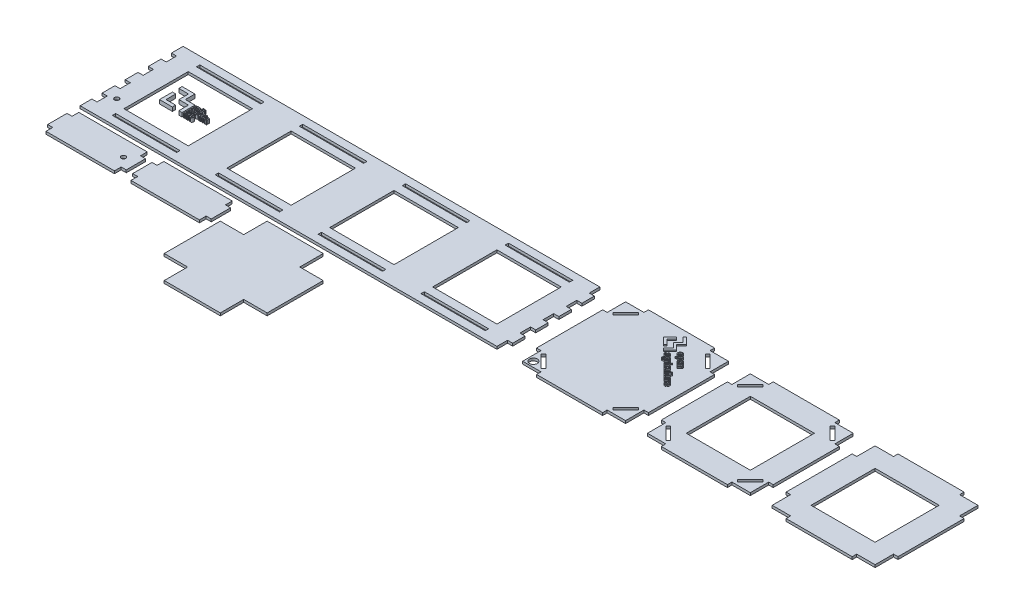
from build123d import *

# Parameters (mm, degrees)
BOSS_EXTRUDE1_DEPTH    = 2.54
SKETCH5_R              = 2.2225
SKETCH5_W              = 63.5
SKETCH5_H              = 3.302
SKETCH5_H_2            = 63.5
CUT_EXTRUDE2_DEPTH     = 265.025638907
BOSS_EXTRUDE2_DEPTH    = 2.54
SKETCH6_W              = 63.246
SKETCH6_H              = 63.246
BOSS_EXTRUDE2_2_DEPTH  = 2.54
BOSS_EXTRUDE2_3_DEPTH  = 2.54
BOSS_EXTRUDE3_DEPTH    = 2.54
BOSS_EXTRUDE3_2_DEPTH  = 2.54
CUT_EXTRUDE3_DEPTH     = 538.737406594
BOSS_EXTRUDE5_DEPTH    = 2.54
SKETCH14_R             = 2.2225
CUT_EXTRUDE4_DEPTH     = 554.485830645
BOSS_EXTRUDE7_DEPTH    = 3.81
BOSS_EXTRUDE7_2_DEPTH  = 3.81
BOSS_EXTRUDE7_3_DEPTH  = 3.81
BOSS_EXTRUDE7_4_DEPTH  = 3.81
BOSS_EXTRUDE7_5_DEPTH  = 3.81
SKETCH13_W             = 0.889033391
SKETCH13_H             = 0.770495605
BOSS_EXTRUDE7_6_DEPTH  = 3.81
SKETCH13_H_2           = 3.378326885
BOSS_EXTRUDE7_7_DEPTH  = 3.81
BOSS_EXTRUDE7_8_DEPTH  = 3.81
BOSS_EXTRUDE7_9_DEPTH  = 3.81
BOSS_EXTRUDE7_10_DEPTH = 3.81
BOSS_EXTRUDE7_11_DEPTH = 3.81
SKETCH13_H_3           = 0.770495606
BOSS_EXTRUDE7_12_DEPTH = 3.81
SKETCH13_H_4           = 3.378326886
BOSS_EXTRUDE7_13_DEPTH = 3.81
BOSS_EXTRUDE7_14_DEPTH = 3.81
SKETCH13_H_5           = 4.622973632
BOSS_EXTRUDE7_15_DEPTH = 3.81
BOSS_EXTRUDE7_16_DEPTH = 3.81
BOSS_EXTRUDE7_17_DEPTH = 3.81
BOSS_EXTRUDE7_18_DEPTH = 3.81
BOSS_EXTRUDE7_19_DEPTH = 3.81
BOSS_EXTRUDE7_20_DEPTH = 3.81
BOSS_EXTRUDE7_21_DEPTH = 3.81
BOSS_EXTRUDE7_22_DEPTH = 3.81
BOSS_EXTRUDE7_23_DEPTH = 3.81
BOSS_EXTRUDE7_24_DEPTH = 3.81
BOSS_EXTRUDE7_25_DEPTH = 3.81
BOSS_EXTRUDE7_26_DEPTH = 3.81
BOSS_EXTRUDE7_27_DEPTH = 3.81
BOSS_EXTRUDE7_28_DEPTH = 3.81
BOSS_EXTRUDE7_29_DEPTH = 3.81
BOSS_EXTRUDE7_30_DEPTH = 3.81
BOSS_EXTRUDE7_31_DEPTH = 3.81
BOSS_EXTRUDE7_32_DEPTH = 3.81
BOSS_EXTRUDE7_33_DEPTH = 3.81
SKETCH15_R             = 3.8725
CUT_EXTRUDE5_DEPTH     = 554.485830646


with BuildPart() as part:
    # Sketch1 → Boss-Extrude1 (new body)
    with BuildSketch(Plane(origin=(0, 0, 0), x_dir=(1, 0, 0), z_dir=(0, 1, 0))):
        Polygon((50.8, 50.8), (152.4, 50.8), (152.4, 40.3352), (157.48, 40.3352), (157.48, 28.0162), (152.4, 28.0162), (152.4, 17.5514), (157.48, 17.5514), (157.48, 5.2324), (152.4, 5.2324), (152.4, -5.2324), (157.48, -5.2324), (157.48, -17.5514), (152.4, -17.5514), (152.4, -28.0162), (157.48, -28.0162), (157.48, -40.3352), (152.4, -40.3352), (152.4, -50.8), (50.8, -50.8), (-50.8, -50.8), (-152.4, -50.8), (-254, -50.8), (-259.08, -50.8), (-259.08, -39.2557), (-254, -39.2557), (-254, -29.0957), (-259.08, -29.0957), (-259.08, -16.4719), (-254, -16.4719), (-254, -6.3119), (-259.08, -6.3119), (-259.08, 6.3119), (-254, 6.3119), (-254, 16.4719), (-259.08, 16.4719), (-259.08, 29.0957), (-254, 29.0957), (-254, 39.2557), (-259.08, 39.2557), (-259.08, 50.8), (-254, 50.8), (-152.4, 50.8), (-50.8, 50.8), align=None)
    extrude(amount=BOSS_EXTRUDE1_DEPTH)

    # Sketch5 → Cut-Extrude2 (cut, through all)
    with BuildSketch(Plane(origin=(0, 2.54, 0), x_dir=(1, 0, 0), z_dir=(0, 1, 0))):
        with Locations((-246.95, -26.75)):
            Circle(SKETCH5_R)
        with Locations((-203.2, -41.529)):
            Rectangle(SKETCH5_W, SKETCH5_H)
        with Locations((-101.6, -41.529)):
            Rectangle(SKETCH5_W, SKETCH5_H)
        with Locations((0, -41.529)):
            Rectangle(SKETCH5_W, SKETCH5_H)
        with Locations((101.6, -41.529)):
            Rectangle(SKETCH5_W, SKETCH5_H)
        with Locations((101.6, 41.529)):
            Rectangle(SKETCH5_W, SKETCH5_H)
        with Locations((0, 41.529)):
            Rectangle(SKETCH5_W, SKETCH5_H)
        with Locations((-101.6, 41.529)):
            Rectangle(SKETCH5_W, SKETCH5_H)
        with Locations((-203.2, 41.529)):
            Rectangle(SKETCH5_W, SKETCH5_H)
        with Locations((-203.2, 0)):
            Rectangle(SKETCH5_W, SKETCH5_H_2)
        with Locations((-101.6, 0)):
            Rectangle(SKETCH5_W, SKETCH5_H_2)
        Rectangle(SKETCH5_W, SKETCH5_H_2)
        with Locations((101.6, 0)):
            Rectangle(SKETCH5_W, SKETCH5_H_2)
    extrude(amount=-CUT_EXTRUDE2_DEPTH, mode=Mode.SUBTRACT)


with BuildPart() as body_2:
    # Sketch6 → Boss-Extrude2 (new body)
    with BuildSketch(Plane(origin=(0, 0, 0), x_dir=(1, 0, 0), z_dir=(0, 1, 0))):
        Polygon((177.8, 32.639), (177.8, 50.8), (195.961, 50.8), (195.961, 55.245), (261.239, 55.245), (261.239, 50.8), (279.4, 50.8), (279.4, 32.639), (283.845, 32.639), (283.845, -32.639), (279.4, -32.639), (279.4, -50.8), (261.239, -50.8), (261.239, -55.245), (195.961, -55.245), (195.961, -50.8), (177.8, -50.8), (177.8, -32.639), (173.355, -32.639), (173.355, 32.639), align=None)
    extrude(amount=BOSS_EXTRUDE2_DEPTH)


with BuildPart() as body_3:
    # Sketch6 → Boss-Extrude2 2 (new body)
    with BuildSketch(Plane(origin=(0, 0, 0), x_dir=(1, 0, 0), z_dir=(0, 1, 0))):
        Polygon((296.545, 32.639), (296.545, -32.639), (300.99, -32.639), (300.99, -50.8), (319.151, -50.8), (319.151, -55.245), (384.429, -55.245), (384.429, -50.8), (402.59, -50.8), (402.59, -32.639), (407.035, -32.639), (407.035, 32.639), (402.59, 32.639), (402.59, 50.8), (384.429, 50.8), (384.429, 55.245), (319.151, 55.245), (319.151, 50.8), (300.99, 50.8), (300.99, 32.639), align=None)
        with Locations((351.79, 0)):
            Rectangle(SKETCH6_W, SKETCH6_H, mode=Mode.SUBTRACT)
    extrude(amount=BOSS_EXTRUDE2_2_DEPTH)


with BuildPart() as body_4:
    # Sketch6 → Boss-Extrude2 3 (new body)
    with BuildSketch(Plane(origin=(0, 0, 0), x_dir=(1, 0, 0), z_dir=(0, 1, 0))):
        Polygon((419.735, 32.639), (419.735, -32.639), (424.18, -32.639), (424.18, -50.8), (442.341, -50.8), (442.341, -55.245), (507.619, -55.245), (507.619, -50.8), (525.78, -50.8), (525.78, -32.639), (530.225, -32.639), (530.225, 32.639), (525.78, 32.639), (525.78, 50.8), (507.619, 50.8), (507.619, 55.245), (442.341, 55.245), (442.341, 50.8), (424.18, 50.8), (424.18, 32.639), align=None)
        with Locations((474.98, 0)):
            Rectangle(SKETCH6_W, SKETCH6_H, mode=Mode.SUBTRACT)
    extrude(amount=BOSS_EXTRUDE2_3_DEPTH)


with BuildPart() as body_5:
    # Sketch7 → Boss-Extrude3 (new body)
    with BuildSketch(Plane(origin=(0, 0, 0), x_dir=(1, 0, 0), z_dir=(0, 1, 0))):
        Polygon((-254.08, -57.15), (-186.516, -57.15), (-186.516, -63.8175), (-181.516, -63.8175), (-181.516, -82.8675), (-186.516, -82.8675), (-186.516, -89.535), (-254.08, -89.535), (-254.08, -82.8675), (-259.08, -82.8675), (-259.08, -63.8175), (-254.08, -63.8175), align=None)
    extrude(amount=BOSS_EXTRUDE3_DEPTH)

    # Sketch14 → Cut-Extrude4 (cut, through all)
    with BuildSketch(Plane(origin=(0, 2.54, 0), x_dir=(1, 0, 0), z_dir=(0, 1, 0))):
        with Locations((-193.7385, -73.3425)):
            Circle(SKETCH14_R)
    extrude(amount=-CUT_EXTRUDE4_DEPTH, mode=Mode.SUBTRACT)


with BuildPart() as body_6:
    # Sketch7 → Boss-Extrude3 2 (new body)
    with BuildSketch(Plane(origin=(0, 0, 0), x_dir=(1, 0, 0), z_dir=(0, 1, 0))):
        Polygon((-170.166, -57.15), (-102.602, -57.15), (-102.602, -63.8175), (-97.602, -63.8175), (-97.602, -82.8675), (-102.602, -82.8675), (-102.602, -89.535), (-170.166, -89.535), (-170.166, -82.8675), (-175.166, -82.8675), (-175.166, -63.8175), (-170.166, -63.8175), align=None)
    extrude(amount=BOSS_EXTRUDE3_2_DEPTH)


with BuildPart() as cut_extrude3_tool:
    # Sketch8 → Cut-Extrude3 (new, through all)
    with BuildSketch(Plane(origin=(0, 2.54, 0), x_dir=(1, 0, 0), z_dir=(0, 1, 0))):
        Polygon((180.594320715, -35.433320715), (193.166679285, -48.005679285), (195.501545876, -45.670812693), (182.929187307, -33.098454124), align=None)
        Polygon((195.501545876, 45.670812693), (182.929187307, 33.098454124), (180.594320715, 35.433320715), (193.166679285, 48.005679285), align=None)
        Polygon((274.270812693, 33.098454124), (261.698454124, 45.670812693), (264.033320715, 48.005679285), (276.605679285, 35.433320715), align=None)
        Polygon((261.698454124, -45.670812693), (274.270812693, -33.098454124), (276.605679285, -35.433320715), (264.033320715, -48.005679285), align=None)
        Polygon((303.784320715, -35.433320715), (306.119187307, -33.098454124), (318.691545876, -45.670812693), (316.356679285, -48.005679285), align=None)
        Polygon((306.119187307, 33.098454124), (303.784320715, 35.433320715), (316.356679285, 48.005679285), (318.691545876, 45.670812693), align=None)
        Polygon((384.888454124, 45.670812693), (387.223320715, 48.005679285), (399.795679285, 35.433320715), (397.460812693, 33.098454124), align=None)
        Polygon((397.460812693, -33.098454124), (399.795679285, -35.433320715), (387.223320715, -48.005679285), (384.888454124, -45.670812693), align=None)
    extrude(amount=-CUT_EXTRUDE3_DEPTH)


with BuildPart() as body_2_1:
    add(body_2.part)

    # Cut-Extrude3: cut by cut_extrude3_tool
    add(cut_extrude3_tool.part, mode=Mode.SUBTRACT)

    # Sketch15 → Cut-Extrude5 (cut, through all)
    with BuildSketch(Plane(origin=(0, 2.54, 0), x_dir=(1, 0, 0), z_dir=(0, 1, 0))):
        with Locations((183.119233747, -45.480766253)):
            Circle(SKETCH15_R)
    extrude(amount=-CUT_EXTRUDE5_DEPTH, mode=Mode.SUBTRACT)


with BuildPart() as body_3_1:
    add(body_3.part)

    # Cut-Extrude3: cut by cut_extrude3_tool
    add(cut_extrude3_tool.part, mode=Mode.SUBTRACT)


with BuildPart() as body_7:
    # Sketch11 → Boss-Extrude5 (new body)
    with BuildSketch(Plane(origin=(0, 0, 0), x_dir=(1, 0, 0), z_dir=(0, 1, 0))):
        Polygon((-68.138, -80.264), (-91.252, -80.264), (-91.252, -135.636), (-68.138, -135.636), (-68.138, -158.75), (-12.766, -158.75), (-12.766, -135.636), (10.348, -135.636), (10.348, -80.264), (-12.766, -80.264), (-12.766, -57.15), (-68.138, -57.15), align=None)
    extrude(amount=BOSS_EXTRUDE5_DEPTH)


with BuildPart() as body_8:
    # Sketch13 → Boss-Extrude7 (new body)
    with BuildSketch(Plane(origin=(0, 0, 0), x_dir=(1, 0, 0), z_dir=(0, 1, 0))):
        Polygon((-223.944332906, 14.661616119), (-211.179668955, 14.661616119), (-211.179668955, 5.178647687), (-201.719332906, 5.178647687), (-201.719332906, -7.608648647), (-204.910498894, -7.608648647), (-204.910498894, 1.942216934), (-214.34820256, 1.942216934), (-214.34820256, 11.470450131), (-223.944332906, 11.470450131), align=None)
    extrude(amount=BOSS_EXTRUDE7_DEPTH)


with BuildPart() as body_9:
    # Sketch13 → Boss-Extrude7 2 (new body)
    with BuildSketch(Plane(origin=(0, 0, 0), x_dir=(1, 0, 0), z_dir=(0, 1, 0))):
        Polygon((239.1402311, 49.535325027), (245.587359985, 43.088196142), (240.797737639, 38.298573796), (245.575928905, 33.52038253), (239.117368941, 27.061822565), (237.505586719, 28.673604787), (242.329502304, 33.497520371), (237.562742117, 38.264280558), (242.375226622, 43.076765062), (237.528448878, 47.923542806), align=None)
    extrude(amount=BOSS_EXTRUDE7_2_DEPTH)


with BuildPart() as body_10:
    # Sketch13 → Boss-Extrude7 3 (new body)
    with BuildSketch(Plane(origin=(0, 0, 0), x_dir=(1, 0, 0), z_dir=(0, 1, 0))):
        Polygon((234.350608754, 44.745702682), (235.973822055, 43.122489381), (231.138475391, 38.287142717), (235.962390975, 33.463227132), (234.339177675, 31.840013831), (227.892048789, 38.287142717), align=None)
    extrude(amount=BOSS_EXTRUDE7_3_DEPTH)


with BuildPart() as body_11:
    # Sketch13 → Boss-Extrude7 4 (new body)
    with BuildSketch(Plane(origin=(0, 0, 0), x_dir=(1, 0, 0), z_dir=(0, 1, 0))):
        Polygon((-223.944332906, 5.178647687), (-220.730534535, 5.178647687), (-220.730534535, -4.394850276), (-211.179668955, -4.394850276), (-211.179668955, -7.608648647), (-223.944332906, -7.608648647), align=None)
    extrude(amount=BOSS_EXTRUDE7_4_DEPTH)


with BuildPart() as body_12:
    # Sketch13 → Boss-Extrude7 5 (new body)
    with BuildSketch(Plane(origin=(0, 0, 0), x_dir=(1, 0, 0), z_dir=(0, 1, 0))):
        with BuildLine():
            Line((-200.498406195, 5.320543819), (-199.609372804, 5.320543819))
            Line((-199.609372804, 5.320543819), (-199.609372804, 4.867692436))
            add(Edge.make_bspline(
                [(-199.609372804, 4.867692436), (-199.574407073, 4.908620525), (-199.506204678, 4.988452795), (-199.392068255, 5.092180744), (-199.274064444, 5.181346788), (-199.150703442, 5.253783352), (-199.02211621, 5.310452487), (-198.888276949, 5.349922399), (-198.749361443, 5.374969606), (-198.655002556, 5.37818777), (-198.607358086, 5.379812712)],
                knots=[0, 0, 0, 0, 1.107989097, 2.161187726, 3.169782568, 4.150299753, 5.101422349, 6.057126037, 7.018988, 8, 8, 8, 8], degree=3))
            add(Edge.make_bspline(
                [(-198.607358086, 5.379812712), (-198.557586002, 5.378083953), (-198.460571565, 5.374714301), (-198.319767091, 5.352271201), (-198.189969241, 5.310630654), (-198.069977842, 5.255025166), (-197.960190972, 5.182910554), (-197.86133589, 5.093686138), (-197.77242436, 4.988334941), (-197.72377622, 4.908535467), (-197.69887709, 4.867692436)],
                knots=[0, 0, 0, 0, 1.087442074, 2.119613481, 3.102840357, 4.056171906, 5.000733146, 5.960649063, 6.95621775, 8, 8, 8, 8], degree=3))
            add(Edge.make_bspline(
                [(-197.69887709, 4.867692436), (-197.66232208, 4.908609573), (-197.590777141, 4.988692006), (-197.472693825, 5.0926344), (-197.351753437, 5.182503827), (-197.22508518, 5.253770075), (-197.094071492, 5.310003707), (-196.959164228, 5.351203441), (-196.818994252, 5.374673624), (-196.724420517, 5.378084177), (-196.676488691, 5.379812712)],
                knots=[0, 0, 0, 0, 1.113435884, 2.179200698, 3.188655475, 4.168472025, 5.123401892, 6.079401341, 7.026602871, 8, 8, 8, 8], degree=3))
            add(Edge.make_bspline(
                [(-196.676488691, 5.379812712), (-196.617405007, 5.378223851), (-196.502810995, 5.375142222), (-196.338364703, 5.346106293), (-196.187777919, 5.298704524), (-196.051748987, 5.23298845), (-195.930188311, 5.148836315), (-195.8259947, 5.045679711), (-195.736597905, 4.925411933), (-195.693069941, 4.834583263), (-195.670769667, 4.788049861)],
                knots=[0, 0, 0, 0, 1.140878793, 2.212757745, 3.214472279, 4.182883268, 5.121137096, 6.057549851, 7.004842706, 8, 8, 8, 8], degree=3))
            add(Edge.make_bspline(
                [(-195.670769667, 4.788049861), (-195.66336462, 4.768705786), (-195.647815203, 4.728086318), (-195.629535813, 4.661420795), (-195.614174761, 4.586832272), (-195.601149048, 4.503700528), (-195.591365756, 4.412521487), (-195.583626879, 4.312784047), (-195.580621321, 4.204947093), (-195.579610237, 4.130226967), (-195.579088099, 4.091640372)],
                knots=[0, 0, 0, 0, 0.70348757, 1.477211565, 2.345356006, 3.290383569, 4.335215205, 5.460703428, 6.68866909, 8, 8, 8, 8], degree=3))
            Line((-195.579088099, 4.091640372), (-195.579088099, 1.942216934))
            Line((-195.579088099, 1.942216934), (-196.46812149, 1.942216934))
            Line((-196.46812149, 1.942216934), (-196.46812149, 3.883273171))
            add(Edge.make_bspline(
                [(-196.46812149, 3.883273171), (-196.468639436, 3.923403333), (-196.469631714, 4.000284427), (-196.472609626, 4.109973335), (-196.480181651, 4.208503671), (-196.490082782, 4.295665819), (-196.502715905, 4.371828204), (-196.518323279, 4.436834232), (-196.535863627, 4.491378021), (-196.552305401, 4.522132594), (-196.559803058, 4.536157067)],
                knots=[0, 0, 0, 0, 1.448583407, 2.775186282, 3.959557885, 5.014017743, 5.940851432, 6.743435621, 7.42699079, 8, 8, 8, 8], degree=3))
            add(Edge.make_bspline(
                [(-196.559803058, 4.536157067), (-196.570161354, 4.551630822), (-196.590496707, 4.582008817), (-196.628111569, 4.620899722), (-196.669459736, 4.654027357), (-196.71515556, 4.680709904), (-196.764429966, 4.702440095), (-196.818140431, 4.716945254), (-196.875856757, 4.726678104), (-196.915990272, 4.727454132), (-196.936716173, 4.727854892)],
                knots=[0, 0, 0, 0, 1.007330723, 1.977586358, 2.91811154, 3.870610884, 4.837109745, 5.827490497, 6.87806446, 8, 8, 8, 8], degree=3))
            add(Edge.make_bspline(
                [(-196.936716173, 4.727854892), (-196.967397109, 4.72636791), (-197.028571805, 4.723403017), (-197.118730631, 4.701241979), (-197.205828261, 4.664548622), (-197.288467574, 4.613636415), (-197.365511886, 4.550293248), (-197.429498008, 4.470416455), (-197.484075631, 4.378844842), (-197.518120283, 4.29161005), (-197.539928546, 4.213422287), (-197.554401707, 4.145654417), (-197.567804026, 4.070081078), (-197.57599382, 3.985811291), (-197.584965097, 3.894216174), (-197.589935152, 3.794100174), (-197.594030483, 3.686361977), (-197.594162354, 3.611629001), (-197.594230451, 3.57303756)],
                knots=[0, 0, 0, 0, 0.980756864, 1.955530408, 2.951333081, 3.992841588, 5.051067304, 6.124479263, 7.24895299, 8.449987866, 9.106471564, 9.844417254, 10.665838362, 11.560007627, 12.551443477, 13.609669193, 14.765654547, 16, 16, 16, 16], degree=3))
            Line((-197.594230451, 3.57303756), (-197.594230451, 1.942216934))
            Line((-197.594230451, 1.942216934), (-198.483263842, 1.942216934))
            Line((-198.483263842, 1.942216934), (-198.483263842, 3.803630596))
            add(Edge.make_bspline(
                [(-198.483263842, 3.803630596), (-198.48351369, 3.843143723), (-198.483989988, 3.918469852), (-198.485584621, 4.025914874), (-198.489071858, 4.122270538), (-198.494875763, 4.20745063), (-198.500828244, 4.281967546), (-198.509245512, 4.34524419), (-198.517905972, 4.398014729), (-198.532564355, 4.452189067), (-198.553941277, 4.509480249), (-198.587685837, 4.568109158), (-198.62675081, 4.618706073), (-198.674008757, 4.659295679), (-198.729179192, 4.690256931), (-198.792342115, 4.712717878), (-198.864318465, 4.725232436), (-198.915076054, 4.726953238), (-198.941671684, 4.727854892)],
                knots=[0, 0, 0, 0, 1.59971622, 3.049630259, 4.350321007, 5.502524502, 6.50613666, 7.375761863, 8.086687183, 8.668722719, 9.645840515, 10.55265597, 11.397779758, 12.221945254, 13.055906891, 13.945332132, 14.923408514, 16, 16, 16, 16], degree=3))
            add(Edge.make_bspline(
                [(-198.941671684, 4.727854892), (-198.97480167, 4.726330443), (-199.039848082, 4.723337387), (-199.135051627, 4.702591511), (-199.224621766, 4.666931011), (-199.308128271, 4.617742253), (-199.383962562, 4.555623367), (-199.44821618, 4.479358239), (-199.501552657, 4.391355426), (-199.535254295, 4.3079778), (-199.55711981, 4.232997333), (-199.57048404, 4.166928812), (-199.582504803, 4.092479146), (-199.592718277, 4.009404844), (-199.599740234, 3.917303917), (-199.605174411, 3.816645052), (-199.609152017, 3.707349702), (-199.609297441, 3.631692913), (-199.609372804, 3.592485166)],
                knots=[0, 0, 0, 0, 1.061105177, 2.08334182, 3.104381884, 4.137278018, 5.176827868, 6.229094397, 7.316239487, 8.460364206, 9.09881589, 9.816452537, 10.617971519, 11.514628853, 12.496857794, 13.576419947, 14.74402393, 16, 16, 16, 16], degree=3))
            Line((-199.609372804, 3.592485166), (-199.609372804, 1.942216934))
            Line((-199.609372804, 1.942216934), (-200.498406195, 1.942216934))
            Line((-200.498406195, 1.942216934), (-200.498406195, 5.320543819))
        make_face()
    extrude(amount=BOSS_EXTRUDE7_5_DEPTH)


with BuildPart() as body_13:
    # Sketch13 → Boss-Extrude7 6 (new body)
    with BuildSketch(Plane(origin=(0, 0, 0), x_dir=(1, 0, 0), z_dir=(0, 1, 0))):
        with Locations((-194.245538013, 6.179942763)):
            Rectangle(SKETCH13_W, SKETCH13_H)
    extrude(amount=BOSS_EXTRUDE7_6_DEPTH)


with BuildPart() as body_14:
    # Sketch13 → Boss-Extrude7 7 (new body)
    with BuildSketch(Plane(origin=(0, 0, 0), x_dir=(1, 0, 0), z_dir=(0, 1, 0))):
        with Locations((-194.245538013, 3.631380377)):
            Rectangle(SKETCH13_W, SKETCH13_H_2)
    extrude(amount=BOSS_EXTRUDE7_7_DEPTH)


with BuildPart() as body_15:
    # Sketch13 → Boss-Extrude7 8 (new body)
    with BuildSketch(Plane(origin=(0, 0, 0), x_dir=(1, 0, 0), z_dir=(0, 1, 0))):
        with BuildLine():
            Line((-191.311727822, 5.320543819), (-191.311727822, 4.668585999))
            Line((-191.311727822, 4.668585999), (-191.963685642, 4.668585999))
            Line((-191.963685642, 4.668585999), (-191.963685642, 3.216498127))
            add(Edge.make_bspline(
                [(-191.963685642, 3.216498127), (-191.963753292, 3.181615844), (-191.963880813, 3.11586274), (-191.9630419, 3.022938717), (-191.961070167, 2.941447566), (-191.959022693, 2.871385342), (-191.95799284, 2.812657473), (-191.95399024, 2.765751528), (-191.95035415, 2.730259295), (-191.944711139, 2.686548863), (-191.918791149, 2.633669834), (-191.875742138, 2.587453943), (-191.831489415, 2.560626694), (-191.793925098, 2.545827568), (-191.753022768, 2.536166425), (-191.724504828, 2.535332001), (-191.709940695, 2.534905861)],
                knots=[0, 0, 0, 0, 1.772607892, 3.341365874, 4.72216035, 5.914769548, 6.903535532, 7.706019004, 8.305410619, 8.718065781, 9.939723765, 11.215765275, 11.877591902, 12.553399735, 13.261220211, 14, 14, 14, 14], degree=3))
            add(Edge.make_bspline(
                [(-191.709940695, 2.534905861), (-191.686113438, 2.536253448), (-191.633422795, 2.539233448), (-191.547932929, 2.556354653), (-191.448850059, 2.583602378), (-191.378899936, 2.60735722), (-191.341362269, 2.620104894)],
                knots=[0, 0, 0, 0, 0.753421026, 1.666085143, 2.747540144, 4, 4, 4, 4], degree=3))
            Line((-191.341362269, 2.620104894), (-191.252458929, 2.00055975))
            add(Edge.make_bspline(
                [(-191.252458929, 2.00055975), (-191.306446419, 1.982038649), (-191.416271475, 1.944361756), (-191.591204392, 1.910083833), (-191.775673394, 1.886801534), (-191.902484758, 1.884252632), (-191.967389948, 1.882948041)],
                knots=[0, 0, 0, 0, 0.939547081, 1.911291127, 2.930947196, 4, 4, 4, 4], degree=3))
            add(Edge.make_bspline(
                [(-191.967389948, 1.882948041), (-192.007252174, 1.884132492), (-192.085095323, 1.886445495), (-192.199083239, 1.901106307), (-192.306747118, 1.927101381), (-192.407313254, 1.962930277), (-192.498134389, 2.006958473), (-192.578124948, 2.056379074), (-192.643739902, 2.113874414), (-192.69854891, 2.177334154), (-192.741779743, 2.251019069), (-192.77610046, 2.33486894), (-192.805596196, 2.429253061), (-192.817679301, 2.496756739), (-192.824010663, 2.532127632)],
                knots=[0, 0, 0, 0, 1.203015215, 2.349253984, 3.460901624, 4.539344044, 5.564274864, 6.502382232, 7.367332183, 8.186789841, 9.022345106, 9.932420497, 10.916620053, 12, 12, 12, 12], degree=3))
            add(Edge.make_bspline(
                [(-192.824010663, 2.532127632), (-192.82623066, 2.54693585), (-192.831169779, 2.579881644), (-192.837871101, 2.634471823), (-192.842006083, 2.699403351), (-192.845394555, 2.774443762), (-192.849741111, 2.859608919), (-192.850660087, 2.954732256), (-192.853319819, 3.059979327), (-192.852925905, 3.133457729), (-192.852719033, 3.172046458)],
                knots=[0, 0, 0, 0, 0.560521704, 1.24706641, 2.057998689, 2.995119087, 4.059211621, 5.249632546, 6.555586685, 8, 8, 8, 8], degree=3))
            Line((-192.852719033, 3.172046458), (-192.852719033, 4.668585999))
            Line((-192.852719033, 4.668585999), (-193.267601282, 4.668585999))
            Line((-193.267601282, 4.668585999), (-193.267601282, 5.320543819))
            Line((-193.267601282, 5.320543819), (-192.852719033, 5.320543819))
            Line((-192.852719033, 5.320543819), (-192.852719033, 5.972501639))
            Line((-192.852719033, 5.972501639), (-191.963685642, 6.505921674))
            Line((-191.963685642, 6.505921674), (-191.963685642, 5.320543819))
            Line((-191.963685642, 5.320543819), (-191.311727822, 5.320543819))
        make_face()
    extrude(amount=BOSS_EXTRUDE7_8_DEPTH)


with BuildPart() as body_16:
    # Sketch13 → Boss-Extrude7 9 (new body)
    with BuildSketch(Plane(origin=(0, 0, 0), x_dir=(1, 0, 0), z_dir=(0, 1, 0))):
        with BuildLine():
            Line((-200.498406195, 1.022647972), (-199.609372804, 1.022647972))
            Line((-199.609372804, 1.022647972), (-199.609372804, 0.569796588))
            add(Edge.make_bspline(
                [(-199.609372804, 0.569796588), (-199.574407073, 0.610724678), (-199.506204678, 0.690556948), (-199.392068255, 0.794284897), (-199.274064444, 0.883450941), (-199.150703442, 0.955887505), (-199.02211621, 1.01255664), (-198.888276949, 1.052026552), (-198.749361443, 1.077073758), (-198.655002556, 1.080291922), (-198.607358086, 1.081916864)],
                knots=[0, 0, 0, 0, 1.107989097, 2.161187726, 3.169782568, 4.150299753, 5.101422349, 6.057126037, 7.018988, 8, 8, 8, 8], degree=3))
            add(Edge.make_bspline(
                [(-198.607358086, 1.081916864), (-198.557586002, 1.080188105), (-198.460571565, 1.076818453), (-198.319767091, 1.054375354), (-198.189969241, 1.012734806), (-198.069977842, 0.957129319), (-197.960190972, 0.885014706), (-197.86133589, 0.79579029), (-197.77242436, 0.690439094), (-197.72377622, 0.61063962), (-197.69887709, 0.569796588)],
                knots=[0, 0, 0, 0, 1.087442074, 2.119613481, 3.102840357, 4.056171906, 5.000733146, 5.960649063, 6.95621775, 8, 8, 8, 8], degree=3))
            add(Edge.make_bspline(
                [(-197.69887709, 0.569796588), (-197.66232208, 0.610713725), (-197.590777141, 0.690796158), (-197.472693825, 0.794738552), (-197.351753437, 0.88460798), (-197.22508518, 0.955874228), (-197.094071492, 1.012107859), (-196.959164228, 1.053307593), (-196.818994252, 1.076777776), (-196.724420517, 1.080188329), (-196.676488691, 1.081916864)],
                knots=[0, 0, 0, 0, 1.113435884, 2.179200698, 3.188655475, 4.168472025, 5.123401892, 6.079401341, 7.026602871, 8, 8, 8, 8], degree=3))
            add(Edge.make_bspline(
                [(-196.676488691, 1.081916864), (-196.617405007, 1.080328003), (-196.502810995, 1.077246374), (-196.338364703, 1.048210445), (-196.187777919, 1.000808677), (-196.051748987, 0.935092602), (-195.930188311, 0.850940467), (-195.8259947, 0.747783863), (-195.736597905, 0.627516085), (-195.693069941, 0.536687415), (-195.670769667, 0.490154014)],
                knots=[0, 0, 0, 0, 1.140878793, 2.212757745, 3.214472279, 4.182883268, 5.121137096, 6.057549851, 7.004842706, 8, 8, 8, 8], degree=3))
            add(Edge.make_bspline(
                [(-195.670769667, 0.490154014), (-195.66336462, 0.470809939), (-195.647815203, 0.43019047), (-195.629535813, 0.363524948), (-195.614174761, 0.288936425), (-195.601149048, 0.20580468), (-195.591365756, 0.11462564), (-195.583626879, 0.014888199), (-195.580621321, -0.092948755), (-195.579610237, -0.16766888), (-195.579088099, -0.206255476)],
                knots=[0, 0, 0, 0, 0.70348757, 1.477211565, 2.345356006, 3.290383569, 4.335215205, 5.460703428, 6.68866909, 8, 8, 8, 8], degree=3))
            Line((-195.579088099, -0.206255476), (-195.579088099, -2.355678914))
            Line((-195.579088099, -2.355678914), (-196.46812149, -2.355678914))
            Line((-196.46812149, -2.355678914), (-196.46812149, -0.414622677))
            add(Edge.make_bspline(
                [(-196.46812149, -0.414622677), (-196.468639436, -0.374492514), (-196.469631714, -0.29761142), (-196.472609626, -0.187922512), (-196.480181651, -0.089392176), (-196.490082782, -0.002230029), (-196.502715905, 0.073932356), (-196.518323279, 0.138938385), (-196.535863627, 0.193482174), (-196.552305401, 0.224236746), (-196.559803058, 0.238261219)],
                knots=[0, 0, 0, 0, 1.448583407, 2.775186282, 3.959557885, 5.014017743, 5.940851432, 6.743435621, 7.42699079, 8, 8, 8, 8], degree=3))
            add(Edge.make_bspline(
                [(-196.559803058, 0.238261219), (-196.570161354, 0.253734975), (-196.590496707, 0.28411297), (-196.628111569, 0.323003875), (-196.669459736, 0.35613151), (-196.71515556, 0.382814057), (-196.764429966, 0.404544248), (-196.818140431, 0.419049406), (-196.875856757, 0.428782256), (-196.915990272, 0.429558285), (-196.936716173, 0.429959044)],
                knots=[0, 0, 0, 0, 1.007330723, 1.977586358, 2.91811154, 3.870610884, 4.837109745, 5.827490497, 6.87806446, 8, 8, 8, 8], degree=3))
            add(Edge.make_bspline(
                [(-196.936716173, 0.429959044), (-196.967397109, 0.428472062), (-197.028571805, 0.42550717), (-197.118730631, 0.403346132), (-197.205828261, 0.366652774), (-197.288467574, 0.315740567), (-197.365511886, 0.2523974), (-197.429498008, 0.172520608), (-197.484075631, 0.080948994), (-197.518120283, -0.006285797), (-197.539928546, -0.08447356), (-197.554401707, -0.15224143), (-197.567804026, -0.22781477), (-197.57599382, -0.312084557), (-197.584965097, -0.403679674), (-197.589935152, -0.503795673), (-197.594030483, -0.61153387), (-197.594162354, -0.686266847), (-197.594230451, -0.724858287)],
                knots=[0, 0, 0, 0, 0.980756864, 1.955530408, 2.951333081, 3.992841588, 5.051067304, 6.124479263, 7.24895299, 8.449987866, 9.106471564, 9.844417254, 10.665838362, 11.560007627, 12.551443477, 13.609669193, 14.765654547, 16, 16, 16, 16], degree=3))
            Line((-197.594230451, -0.724858287), (-197.594230451, -2.355678914))
            Line((-197.594230451, -2.355678914), (-198.483263842, -2.355678914))
            Line((-198.483263842, -2.355678914), (-198.483263842, -0.494265252))
            add(Edge.make_bspline(
                [(-198.483263842, -0.494265252), (-198.48351369, -0.454752124), (-198.483989988, -0.379425996), (-198.485584621, -0.271980973), (-198.489071858, -0.175625309), (-198.494875763, -0.090445218), (-198.500828244, -0.015928301), (-198.509245512, 0.047348343), (-198.517905972, 0.100118881), (-198.532564355, 0.15429322), (-198.553941277, 0.211584402), (-198.587685837, 0.270213311), (-198.62675081, 0.320810226), (-198.674008757, 0.361399831), (-198.729179192, 0.392361084), (-198.792342115, 0.41482203), (-198.864318465, 0.427336589), (-198.915076054, 0.42905739), (-198.941671684, 0.429959044)],
                knots=[0, 0, 0, 0, 1.59971622, 3.049630259, 4.350321007, 5.502524502, 6.50613666, 7.375761863, 8.086687183, 8.668722719, 9.645840515, 10.55265597, 11.397779758, 12.221945254, 13.055906891, 13.945332132, 14.923408514, 16, 16, 16, 16], degree=3))
            add(Edge.make_bspline(
                [(-198.941671684, 0.429959044), (-198.97480167, 0.428434596), (-199.039848082, 0.42544154), (-199.135051627, 0.404695663), (-199.224621766, 0.369035164), (-199.308128271, 0.319846406), (-199.383962562, 0.257727519), (-199.44821618, 0.181462391), (-199.501552657, 0.093459578), (-199.535254295, 0.010081953), (-199.55711981, -0.064898514), (-199.57048404, -0.130967035), (-199.582504803, -0.205416701), (-199.592718277, -0.288491004), (-199.599740234, -0.380591931), (-199.605174411, -0.481250795), (-199.609152017, -0.590546146), (-199.609297441, -0.666202934), (-199.609372804, -0.705410682)],
                knots=[0, 0, 0, 0, 1.061105177, 2.08334182, 3.104381884, 4.137278018, 5.176827868, 6.229094397, 7.316239487, 8.460364206, 9.09881589, 9.816452537, 10.617971519, 11.514628853, 12.496857794, 13.576419947, 14.74402393, 16, 16, 16, 16], degree=3))
            Line((-199.609372804, -0.705410682), (-199.609372804, -2.355678914))
            Line((-199.609372804, -2.355678914), (-200.498406195, -2.355678914))
            Line((-200.498406195, -2.355678914), (-200.498406195, 1.022647972))
        make_face()
    extrude(amount=BOSS_EXTRUDE7_9_DEPTH)


with BuildPart() as body_17:
    # Sketch13 → Boss-Extrude7 10 (new body)
    with BuildSketch(Plane(origin=(0, 0, 0), x_dir=(1, 0, 0), z_dir=(0, 1, 0))):
        with BuildLine():
            Line((-192.79345014, -1.288838845), (-191.904416749, -1.40737663))
            add(Edge.make_bspline(
                [(-191.904416749, -1.40737663), (-191.918958133, -1.4474322), (-191.947549593, -1.52618999), (-191.999786377, -1.638489112), (-192.058176819, -1.743299392), (-192.122440206, -1.841180829), (-192.192337376, -1.932261128), (-192.27017956, -2.014624348), (-192.35217465, -2.091336595), (-192.441752466, -2.158745081), (-192.53666851, -2.219367659), (-192.637399781, -2.272411773), (-192.744751846, -2.315611475), (-192.85709905, -2.351788304), (-192.974951349, -2.380664694), (-193.098789557, -2.400852129), (-193.228454791, -2.413117419), (-193.316964469, -2.414329989), (-193.36206108, -2.414947807)],
                knots=[0, 0, 0, 0, 1.071172907, 2.106154283, 3.1104349, 4.085737425, 5.048416355, 5.993087888, 6.932482331, 7.868664062, 8.80754521, 9.762367971, 10.726735429, 11.713584758, 12.728370439, 13.774815933, 14.866245336, 16, 16, 16, 16], degree=3))
            add(Edge.make_bspline(
                [(-193.36206108, -2.414947807), (-193.432532085, -2.413208451), (-193.569381415, -2.409830755), (-193.767370594, -2.382687476), (-193.951260447, -2.338494846), (-194.121405142, -2.276594463), (-194.277239152, -2.195396696), (-194.418997133, -2.096661985), (-194.546957091, -1.980175747), (-194.61867885, -1.889986737), (-194.654863803, -1.844484714)],
                knots=[0, 0, 0, 0, 1.150944905, 2.235047425, 3.25761485, 4.235688044, 5.185329112, 6.119879054, 7.051444229, 8, 8, 8, 8], degree=3))
            add(Edge.make_bspline(
                [(-194.654863803, -1.844484714), (-194.681568307, -1.805762768), (-194.735343383, -1.727788073), (-194.802187778, -1.601441644), (-194.859345325, -1.467970217), (-194.904880626, -1.326991476), (-194.942733079, -1.179041068), (-194.968200725, -1.023179069), (-194.9828795, -0.859732568), (-194.985210076, -0.748349108), (-194.986399171, -0.691519535)],
                knots=[0, 0, 0, 0, 0.92479112, 1.862259343, 2.806490716, 3.778329015, 4.774107667, 5.808532634, 6.881879269, 8, 8, 8, 8], degree=3))
            add(Edge.make_bspline(
                [(-194.986399171, -0.691519535), (-194.985421226, -0.624153212), (-194.983509447, -0.492459292), (-194.960875522, -0.301021445), (-194.928937758, -0.119991289), (-194.880230515, 0.048750467), (-194.819352977, 0.207128664), (-194.742949301, 0.353106638), (-194.654819778, 0.4893397), (-194.551776226, 0.611713459), (-194.438853084, 0.721746666), (-194.318681679, 0.818704383), (-194.190362396, 0.89968973), (-194.055806519, 0.96728384), (-193.912775139, 1.017879531), (-193.763058423, 1.055124602), (-193.606001758, 1.077806348), (-193.498886541, 1.080532321), (-193.444481884, 1.081916864)],
                knots=[0, 0, 0, 0, 1.222152375, 2.389176539, 3.494777592, 4.555389183, 5.572001132, 6.56945427, 7.540785438, 8.511469914, 9.46642023, 10.399267108, 11.30862844, 12.215760073, 13.126777173, 14.056336669, 15.012798191, 16, 16, 16, 16], degree=3))
            add(Edge.make_bspline(
                [(-193.444481884, 1.081916864), (-193.383592029, 1.080629478), (-193.264436966, 1.078110198), (-193.090709317, 1.054459436), (-192.926680524, 1.015990913), (-192.772886386, 0.960713853), (-192.628324033, 0.891399101), (-192.494068625, 0.805497461), (-192.370113271, 0.703793412), (-192.25676408, 0.586330318), (-192.15418113, 0.453880552), (-192.066867048, 0.303889262), (-191.993773095, 0.137906734), (-191.934514839, -0.044494958), (-191.890705903, -0.243697677), (-191.860730001, -0.459183015), (-191.843635236, -0.690931197), (-191.844633137, -0.850776767), (-191.845147857, -0.933225488)],
                knots=[0, 0, 0, 0, 0.994942504, 1.946998194, 2.860087576, 3.744358974, 4.613292, 5.475605888, 6.343365869, 7.228414471, 8.138836547, 9.075277299, 10.058013037, 11.098483422, 12.205225682, 13.387753975, 14.652597341, 16, 16, 16, 16], degree=3))
            Line((-191.845147857, -0.933225488), (-194.09736578, -0.933225488))
            add(Edge.make_bspline(
                [(-194.09736578, -0.933225488), (-194.095907772, -0.96504627), (-194.093068563, -1.027011538), (-194.082313885, -1.117588018), (-194.063695699, -1.202371788), (-194.039330523, -1.281877219), (-194.010357957, -1.356160103), (-193.973502559, -1.424507137), (-193.931040403, -1.487790248), (-193.881951474, -1.544977474), (-193.828203102, -1.595742916), (-193.771486466, -1.64035612), (-193.711888624, -1.679366826), (-193.647869823, -1.709036957), (-193.581558497, -1.734090036), (-193.511760912, -1.750148699), (-193.438944242, -1.760819647), (-193.389265906, -1.762256638), (-193.363913233, -1.762989987)],
                knots=[0, 0, 0, 0, 1.231756261, 2.398624542, 3.522625857, 4.583815436, 5.612473245, 6.600564899, 7.580690863, 8.554470542, 9.508734211, 10.435415665, 11.342824763, 12.255949018, 13.158633635, 14.07945191, 15.019874036, 16, 16, 16, 16], degree=3))
            add(Edge.make_bspline(
                [(-193.363913233, -1.762989987), (-193.330169013, -1.761493753), (-193.264811493, -1.758595772), (-193.170603025, -1.738291104), (-193.085124643, -1.702508875), (-193.007480672, -1.652624203), (-192.938393001, -1.586377295), (-192.880470146, -1.501998471), (-192.829826535, -1.402121945), (-192.805974563, -1.327842311), (-192.79345014, -1.288838845)],
                knots=[0, 0, 0, 0, 1.004430367, 1.945431754, 2.851730883, 3.749038912, 4.678525969, 5.68064125, 6.782128749, 8, 8, 8, 8], degree=3))
        make_face()
        with BuildLine():
            add(Edge.make_bspline(
                [(-192.734181248, -0.399805454), (-192.735711329, -0.367065442), (-192.73869127, -0.303301982), (-192.748411738, -0.210335013), (-192.765098482, -0.123683127), (-192.787046448, -0.042879005), (-192.816331861, 0.031082621), (-192.849027594, 0.100321603), (-192.889124738, 0.162682002), (-192.935056645, 0.218020542), (-192.983507654, 0.268601751), (-193.037065942, 0.310663303), (-193.091219681, 0.348305227), (-193.148769927, 0.378425122), (-193.209120478, 0.401436743), (-193.272068094, 0.418355476), (-193.337722727, 0.427421247), (-193.382101238, 0.429103757), (-193.404660597, 0.429959044)],
                knots=[0, 0, 0, 0, 1.317025077, 2.564998298, 3.752245872, 4.859831213, 5.924126069, 6.944952788, 7.932526842, 8.893486968, 9.832088588, 10.740700482, 11.624936399, 12.479435602, 13.343337491, 14.21592381, 15.09308328, 16, 16, 16, 16], degree=3))
            add(Edge.make_bspline(
                [(-193.404660597, 0.429959044), (-193.428769184, 0.429176472), (-193.476276359, 0.427634375), (-193.545944216, 0.417572473), (-193.611979141, 0.399725935), (-193.674884388, 0.37557155), (-193.734525149, 0.343762754), (-193.790902757, 0.304753189), (-193.84422931, 0.25903125), (-193.876361002, 0.224391883), (-193.892702885, 0.20677462)],
                knots=[0, 0, 0, 0, 1.043516863, 2.056302107, 3.038302912, 3.998520634, 4.966791607, 5.956307719, 6.960596886, 8, 8, 8, 8], degree=3))
            add(Edge.make_bspline(
                [(-193.892702885, 0.20677462), (-193.907934618, 0.187622108), (-193.938537068, 0.149142323), (-193.977349998, 0.08534131), (-194.011158755, 0.017145498), (-194.036353627, -0.057286331), (-194.058479836, -0.135542003), (-194.071458934, -0.21949173), (-194.080202242, -0.307934457), (-194.081140126, -0.368603396), (-194.081622481, -0.399805454)],
                knots=[0, 0, 0, 0, 0.903873942, 1.815995408, 2.755131859, 3.711650387, 4.716574161, 5.757841734, 6.846857195, 8, 8, 8, 8], degree=3))
            Line((-194.081622481, -0.399805454), (-192.734181248, -0.399805454))
        make_face(mode=Mode.SUBTRACT)
    extrude(amount=BOSS_EXTRUDE7_10_DEPTH)


with BuildPart() as body_18:
    # Sketch13 → Boss-Extrude7 11 (new body)
    with BuildSketch(Plane(origin=(0, 0, 0), x_dir=(1, 0, 0), z_dir=(0, 1, 0))):
        with BuildLine():
            Line((-188.170476508, -2.355678914), (-189.059509898, -2.355678914))
            Line((-189.059509898, -2.355678914), (-189.059509898, -1.867636625))
            add(Edge.make_bspline(
                [(-189.059509898, -1.867636625), (-189.091960508, -1.913078598), (-189.155033328, -2.00140216), (-189.267539644, -2.114588232), (-189.385684591, -2.212067756), (-189.514450057, -2.286043218), (-189.646010717, -2.343724308), (-189.779270705, -2.384844676), (-189.91364662, -2.409862267), (-190.003696586, -2.413256698), (-190.048559546, -2.414947807)],
                knots=[0, 0, 0, 0, 1.136300101, 2.208576455, 3.242281452, 4.249058783, 5.223933999, 6.165280663, 7.085941471, 8, 8, 8, 8], degree=3))
            add(Edge.make_bspline(
                [(-190.048559546, -2.414947807), (-190.09308686, -2.413453146), (-190.181112754, -2.410498357), (-190.310992014, -2.389058357), (-190.435646621, -2.351351243), (-190.555677142, -2.300363596), (-190.670642775, -2.234795528), (-190.780425475, -2.154466809), (-190.885243286, -2.059184724), (-190.984987537, -1.950711768), (-191.075413501, -1.828326459), (-191.155616088, -1.694709091), (-191.222353146, -1.548879969), (-191.276796083, -1.391890572), (-191.319304643, -1.223314458), (-191.349711157, -1.043429782), (-191.36700137, -0.852069729), (-191.369641661, -0.720879869), (-191.370996715, -0.653550401)],
                knots=[0, 0, 0, 0, 0.868680302, 1.717291116, 2.559594063, 3.404262612, 4.256691068, 5.136162843, 6.05305749, 7.01654586, 8.006773995, 9.017023416, 10.051895049, 11.130067211, 12.254925639, 13.440213999, 14.686262564, 16, 16, 16, 16], degree=3))
            add(Edge.make_bspline(
                [(-191.370996715, -0.653550401), (-191.369649457, -0.584678245), (-191.367034941, -0.451023475), (-191.349835537, -0.256874356), (-191.3193945, -0.075743578), (-191.276910357, 0.092849173), (-191.222565741, 0.249005038), (-191.155795991, 0.392509545), (-191.076942939, 0.523229359), (-190.985654657, 0.639941601), (-190.885712972, 0.743939861), (-190.778006502, 0.833947822), (-190.664066865, 0.910543566), (-190.54432976, 0.974258965), (-190.417269662, 1.022565406), (-190.28422569, 1.056277096), (-190.145027031, 1.078957149), (-190.049887022, 1.080916735), (-190.001329647, 1.081916864)],
                knots=[0, 0, 0, 0, 1.327136196, 2.575468729, 3.751890053, 4.862767969, 5.921925726, 6.933145827, 7.907387355, 8.856890668, 9.782390252, 10.681851331, 11.556239068, 12.423659137, 13.289752485, 14.16837887, 15.06518071, 16, 16, 16, 16], degree=3))
            add(Edge.make_bspline(
                [(-190.001329647, 1.081916864), (-189.956481281, 1.080474103), (-189.868121933, 1.077631603), (-189.737893848, 1.055564032), (-189.61243265, 1.01978809), (-189.492026753, 0.967698976), (-189.375521278, 0.902840796), (-189.264411543, 0.822560256), (-189.15763156, 0.728260605), (-189.092789353, 0.656589182), (-189.059509898, 0.619804716)],
                knots=[0, 0, 0, 0, 0.992399448, 1.955205421, 2.915485871, 3.87381908, 4.85285833, 5.861755538, 6.90257267, 8, 8, 8, 8], degree=3))
            Line((-189.059509898, 0.619804716), (-189.059509898, 2.267294719))
            Line((-189.059509898, 2.267294719), (-188.170476508, 2.267294719))
            Line((-188.170476508, 2.267294719), (-188.170476508, -2.355678914))
        make_face()
        with BuildLine():
            add(Edge.make_bspline(
                [(-190.481963324, -0.602616196), (-190.481831115, -0.647392561), (-190.481576521, -0.733618199), (-190.473402886, -0.858053117), (-190.463146341, -0.972811827), (-190.446949738, -1.077780584), (-190.428486667, -1.173742098), (-190.403083458, -1.259528785), (-190.375231084, -1.336646004), (-190.350964042, -1.382600332), (-190.339347551, -1.404598401)],
                knots=[0, 0, 0, 0, 1.306099746, 2.515150209, 3.637201974, 4.666415219, 5.613193253, 6.485405436, 7.274972403, 8, 8, 8, 8], degree=3))
            add(Edge.make_bspline(
                [(-190.339347551, -1.404598401), (-190.322180262, -1.433205024), (-190.288961835, -1.488558381), (-190.228354019, -1.560947842), (-190.164940899, -1.624264962), (-190.094108616, -1.674514988), (-190.019119751, -1.715059527), (-189.938342425, -1.742661505), (-189.852977651, -1.760044439), (-189.794284089, -1.761993016), (-189.764254076, -1.762989987)],
                knots=[0, 0, 0, 0, 1.120960711, 2.169040953, 3.168100815, 4.128109154, 5.080726846, 6.026866003, 6.990464429, 8, 8, 8, 8], degree=3))
            add(Edge.make_bspline(
                [(-189.764254076, -1.762989987), (-189.740137303, -1.761946371), (-189.692533754, -1.759886401), (-189.622574573, -1.748161138), (-189.555877156, -1.726131243), (-189.492051413, -1.696299122), (-189.430003951, -1.659154605), (-189.371721659, -1.612224293), (-189.316013423, -1.557208135), (-189.263168212, -1.494275495), (-189.214821045, -1.422894631), (-189.173136615, -1.342649634), (-189.138098559, -1.25375184), (-189.108593863, -1.157220267), (-189.086384007, -1.052134599), (-189.07136507, -0.939118722), (-189.060428928, -0.817677504), (-189.059822622, -0.733837096), (-189.059509898, -0.690593459)],
                knots=[0, 0, 0, 0, 0.808519481, 1.595918141, 2.367946092, 3.154732969, 3.953063559, 4.785064852, 5.655532678, 6.573390792, 7.534530006, 8.538576741, 9.596996712, 10.732480475, 11.917354949, 13.191565377, 14.551451138, 16, 16, 16, 16], degree=3))
            add(Edge.make_bspline(
                [(-189.059509898, -0.690593459), (-189.059931922, -0.642729763), (-189.06074689, -0.550300405), (-189.07009146, -0.416740366), (-189.085427471, -0.293277872), (-189.107605243, -0.180383242), (-189.134978362, -0.077645967), (-189.169206722, 0.014546336), (-189.209508847, 0.096657867), (-189.257335997, 0.167672294), (-189.309922302, 0.228736897), (-189.364009576, 0.283371763), (-189.423410466, 0.327983012), (-189.485532096, 0.365521244), (-189.551859257, 0.394519788), (-189.621981519, 0.414504242), (-189.695177508, 0.428401407), (-189.745357905, 0.429435867), (-189.770736611, 0.429959044)],
                knots=[0, 0, 0, 0, 1.538844071, 2.971654591, 4.302575584, 5.536777829, 6.668535022, 7.717613974, 8.694219699, 9.60272161, 10.461894315, 11.283130947, 12.06930595, 12.843865074, 13.612870817, 14.388700961, 15.185086457, 16, 16, 16, 16], degree=3))
            add(Edge.make_bspline(
                [(-189.770736611, 0.429959044), (-189.795481407, 0.42933073), (-189.844349986, 0.428089869), (-189.915914848, 0.415734942), (-189.984364892, 0.395257946), (-190.049392689, 0.366090258), (-190.112034298, 0.329806658), (-190.171517023, 0.285169905), (-190.227303333, 0.231631688), (-190.279794863, 0.170650119), (-190.32872967, 0.102288809), (-190.368767792, 0.024413126), (-190.404487478, -0.06020989), (-190.432874962, -0.153353405), (-190.454960366, -0.254338665), (-190.470144272, -0.363335095), (-190.481044912, -0.480154419), (-190.481650583, -0.560915043), (-190.481963324, -0.602616196)],
                knots=[0, 0, 0, 0, 0.844531552, 1.667868134, 2.47173451, 3.278912967, 4.096287191, 4.939765054, 5.812329042, 6.731790039, 7.685377109, 8.6758465, 9.71559549, 10.819442259, 11.996209133, 13.242749135, 14.576279701, 16, 16, 16, 16], degree=3))
        make_face(mode=Mode.SUBTRACT)
    extrude(amount=BOSS_EXTRUDE7_11_DEPTH)


with BuildPart() as body_19:
    # Sketch13 → Boss-Extrude7 12 (new body)
    with BuildSketch(Plane(origin=(0, 0, 0), x_dir=(1, 0, 0), z_dir=(0, 1, 0))):
        with Locations((-186.777657529, 1.882046916)):
            Rectangle(SKETCH13_W, SKETCH13_H_3)
    extrude(amount=BOSS_EXTRUDE7_12_DEPTH)


with BuildPart() as body_20:
    # Sketch13 → Boss-Extrude7 13 (new body)
    with BuildSketch(Plane(origin=(0, 0, 0), x_dir=(1, 0, 0), z_dir=(0, 1, 0))):
        with Locations((-186.777657529, -0.666515471)):
            Rectangle(SKETCH13_W, SKETCH13_H_4)
    extrude(amount=BOSS_EXTRUDE7_13_DEPTH)


with BuildPart() as body_21:
    # Sketch13 → Boss-Extrude7 14 (new body)
    with BuildSketch(Plane(origin=(0, 0, 0), x_dir=(1, 0, 0), z_dir=(0, 1, 0))):
        with BuildLine():
            Line((-184.851418515, 0.015076795), (-185.62191412, 0.133614581))
            add(Edge.make_bspline(
                [(-185.62191412, 0.133614581), (-185.610367133, 0.172667221), (-185.587764141, 0.24911197), (-185.546287286, 0.358657987), (-185.497718309, 0.459933185), (-185.444153616, 0.554147462), (-185.383942697, 0.640270873), (-185.318047905, 0.718527458), (-185.246096829, 0.788649384), (-185.167745602, 0.851179517), (-185.081486825, 0.906727474), (-184.985362411, 0.953821086), (-184.879516422, 0.993474578), (-184.764097472, 1.025342091), (-184.639299201, 1.051984565), (-184.504166385, 1.068294685), (-184.359570608, 1.080068059), (-184.259991251, 1.081288502), (-184.208721459, 1.081916864)],
                knots=[0, 0, 0, 0, 1.047140172, 2.049755565, 3.008539736, 3.933190086, 4.833981818, 5.707167246, 6.560530269, 7.413560864, 8.281243119, 9.193714071, 10.161006392, 11.183910126, 12.270717139, 13.439589873, 14.681737877, 16, 16, 16, 16], degree=3))
            add(Edge.make_bspline(
                [(-184.208721459, 1.081916864), (-184.16210055, 1.081658022), (-184.071896418, 1.081157203), (-183.941217274, 1.074591255), (-183.819742437, 1.063824922), (-183.707630842, 1.047910375), (-183.604512989, 1.028985331), (-183.510718206, 1.004986307), (-183.42596725, 0.976664784), (-183.328043033, 0.932639536), (-183.220479032, 0.870772873), (-183.108212758, 0.786768698), (-183.01814142, 0.691209787), (-182.958531345, 0.602023061), (-182.923328023, 0.521185274), (-182.898487356, 0.449962426), (-182.880639169, 0.366745806), (-182.863072337, 0.272726885), (-182.852292123, 0.167396951), (-182.842563281, 0.050730152), (-182.837294261, -0.077175104), (-182.836623939, -0.16643046), (-182.836276162, -0.212738011)],
                knots=[0, 0, 0, 0, 1.253259065, 2.424859341, 3.516580225, 4.530621704, 5.468151732, 6.333678254, 7.13150538, 7.867126506, 9.216626747, 10.459871386, 11.622324159, 12.731817101, 13.322505456, 13.989117254, 14.756090433, 15.607496751, 16.559714447, 17.600403876, 18.755039204, 20, 20, 20, 20], degree=3))
            Line((-182.836276162, -0.212738011), (-182.836276162, -1.25086971))
            add(Edge.make_bspline(
                [(-182.836276162, -1.25086971), (-182.835988184, -1.286676873), (-182.835432052, -1.355826217), (-182.834292032, -1.455899452), (-182.829129945, -1.548485169), (-182.823706485, -1.63369745), (-182.817458185, -1.711868761), (-182.809349749, -1.782638251), (-182.7992033, -1.846312314), (-182.782924714, -1.922358351), (-182.756739698, -2.014622764), (-182.713926816, -2.125216067), (-182.662569284, -2.240408927), (-182.620763984, -2.316454307), (-182.599200591, -2.355678914)],
                knots=[0, 0, 0, 0, 1.124218554, 2.171045354, 3.141373911, 4.034856482, 4.851737235, 5.603038048, 6.270604849, 6.87504238, 8.043824301, 9.276776929, 10.59534724, 12, 12, 12, 12], degree=3))
            Line((-182.599200591, -2.355678914), (-183.488233982, -2.355678914))
            add(Edge.make_bspline(
                [(-183.488233982, -2.355678914), (-183.494579529, -2.337830255), (-183.508483921, -2.298720184), (-183.527261854, -2.233161266), (-183.54976598, -2.156777177), (-183.564603133, -2.10166042), (-183.572506939, -2.072299521)],
                knots=[0, 0, 0, 0, 0.768508203, 1.683958961, 2.766236402, 4, 4, 4, 4], degree=3))
            add(Edge.make_bspline(
                [(-183.572506939, -2.072299521), (-183.575914441, -2.059337568), (-183.5820823, -2.035875367), (-183.590301561, -2.003964339), (-183.597427194, -1.979567367), (-183.602108919, -1.965790229), (-183.603993538, -1.96024427)],
                knots=[0, 0, 0, 0, 1.381357368, 2.500370598, 3.396327181, 4, 4, 4, 4], degree=3))
            add(Edge.make_bspline(
                [(-183.603993538, -1.96024427), (-183.641603516, -1.996504389), (-183.715199923, -2.067459347), (-183.835229665, -2.159353161), (-183.957857936, -2.238462174), (-184.085076852, -2.303024183), (-184.215929718, -2.35348249), (-184.351711981, -2.388668658), (-184.491697785, -2.410562519), (-184.586789984, -2.413478265), (-184.634716626, -2.414947807)],
                knots=[0, 0, 0, 0, 1.082260538, 2.117802027, 3.127898709, 4.103827344, 5.070056335, 6.029309159, 7.006768236, 8, 8, 8, 8], degree=3))
            add(Edge.make_bspline(
                [(-184.634716626, -2.414947807), (-184.676416028, -2.413982604), (-184.757861177, -2.412097421), (-184.87670721, -2.399644294), (-184.988420889, -2.37602566), (-185.093513886, -2.344613883), (-185.192241048, -2.305123157), (-185.283749357, -2.255506503), (-185.36857565, -2.196876367), (-185.44587796, -2.129447409), (-185.515161048, -2.055440696), (-185.575964762, -1.976697927), (-185.626264677, -1.89216313), (-185.667877567, -1.803465896), (-185.700801752, -1.709829702), (-185.7235126, -1.611680521), (-185.737989231, -1.508748973), (-185.739618841, -1.438604449), (-185.740451906, -1.402746248)],
                knots=[0, 0, 0, 0, 1.186431605, 2.317277787, 3.39378889, 4.430144672, 5.434756152, 6.413230964, 7.385260177, 8.362630794, 9.325691837, 10.265445477, 11.187216893, 12.118354241, 13.048828682, 14.005299944, 14.980300216, 16, 16, 16, 16], degree=3))
            add(Edge.make_bspline(
                [(-185.740451906, -1.402746248), (-185.738938854, -1.355703511), (-185.735969955, -1.263396612), (-185.710031656, -1.129292858), (-185.669413547, -1.002619223), (-185.61168267, -0.884964702), (-185.539848114, -0.777382606), (-185.4534304, -0.682422573), (-185.353674992, -0.601567488), (-185.238403512, -0.532903088), (-185.103208907, -0.475061614), (-184.945319745, -0.419340112), (-184.760891815, -0.369400536), (-184.628686371, -0.340828009), (-184.558778357, -0.325719338)],
                knots=[0, 0, 0, 0, 0.9565892, 1.877012003, 2.769038917, 3.656897043, 4.535078379, 5.39337207, 6.259743944, 7.138913465, 8.11486349, 9.247429708, 10.544487161, 12, 12, 12, 12], degree=3))
            add(Edge.make_bspline(
                [(-184.558778357, -0.325719338), (-184.510606787, -0.315917139), (-184.417878209, -0.297048252), (-184.28467804, -0.268678164), (-184.162989228, -0.240083303), (-184.053328184, -0.211034419), (-183.954535246, -0.184641604), (-183.867641499, -0.158046027), (-183.792304059, -0.131278921), (-183.746541407, -0.11227703), (-183.725309553, -0.10346099)],
                knots=[0, 0, 0, 0, 1.365613701, 2.628758346, 3.783158308, 4.837685682, 5.780080249, 6.623655076, 7.36143661, 8, 8, 8, 8], degree=3))
            Line((-183.725309553, -0.10346099), (-183.725309553, -0.019188033))
            add(Edge.make_bspline(
                [(-183.725309553, -0.019188033), (-183.726494219, 0.018592702), (-183.728694211, 0.088753674), (-183.750565783, 0.186041918), (-183.788532482, 0.266174216), (-183.834360606, 0.319581895), (-183.879703016, 0.351799894), (-183.919739972, 0.373242072), (-183.966655931, 0.390354478), (-184.01979188, 0.40552158), (-184.080061041, 0.415885852), (-184.146767682, 0.424491911), (-184.220090625, 0.42871472), (-184.271073762, 0.429532934), (-184.297624798, 0.429959044)],
                knots=[0, 0, 0, 0, 1.600506204, 2.972230995, 4.195852174, 5.327580964, 5.908906329, 6.547275261, 7.247479517, 8.022494018, 8.887774365, 9.837646189, 10.873887764, 12, 12, 12, 12], degree=3))
            add(Edge.make_bspline(
                [(-184.297624798, 0.429959044), (-184.332905971, 0.429116001), (-184.399949342, 0.427514001), (-184.4944294, 0.409589682), (-184.577563858, 0.381492494), (-184.649623896, 0.339544019), (-184.711745102, 0.282557483), (-184.765837621, 0.209071685), (-184.813757636, 0.118766656), (-184.838392623, 0.050940347), (-184.851418515, 0.015076795)],
                knots=[0, 0, 0, 0, 1.120680009, 2.129582446, 3.045508635, 3.899130849, 4.760899303, 5.707254252, 6.787697471, 8, 8, 8, 8], degree=3))
        make_face()
        with BuildLine():
            add(Edge.make_bspline(
                [(-183.725309553, -0.75541881), (-183.755822217, -0.764841402), (-183.824544864, -0.78606359), (-183.939978953, -0.817243616), (-184.079118047, -0.850100283), (-184.207427552, -0.87853068), (-184.314538497, -0.901621727), (-184.390097935, -0.920501477), (-184.458186217, -0.938503867), (-184.518905158, -0.957409183), (-184.572336024, -0.975205301), (-184.617700945, -0.994274265), (-184.656578925, -1.010971918), (-184.678385069, -1.024950846), (-184.68842906, -1.031389592)],
                knots=[0, 0, 0, 0, 1.144223484, 2.577096135, 4.283377528, 6.266557578, 7.286341447, 8.209198618, 9.057088726, 9.80932547, 10.487940513, 11.073343897, 11.57317876, 12, 12, 12, 12], degree=3))
            add(Edge.make_bspline(
                [(-184.68842906, -1.031389592), (-184.71329413, -1.050973442), (-184.761013268, -1.088557268), (-184.813032659, -1.161187207), (-184.846042233, -1.241708261), (-184.849604476, -1.298707655), (-184.851418515, -1.327734056)],
                knots=[0, 0, 0, 0, 1.075028234, 2.063111864, 3.013658082, 4, 4, 4, 4], degree=3))
            add(Edge.make_bspline(
                [(-184.851418515, -1.327734056), (-184.849818526, -1.356614704), (-184.846680028, -1.413266282), (-184.821681786, -1.494898973), (-184.779644741, -1.569687082), (-184.722390842, -1.63617309), (-184.653497076, -1.693732664), (-184.572287167, -1.733184404), (-184.482818604, -1.758658875), (-184.420052311, -1.761509497), (-184.387454214, -1.762989987)],
                knots=[0, 0, 0, 0, 0.976809721, 1.916086158, 2.861451878, 3.862738809, 4.873423621, 5.878632484, 6.898253484, 8, 8, 8, 8], degree=3))
            add(Edge.make_bspline(
                [(-184.387454214, -1.762989987), (-184.350205274, -1.761304533), (-184.275216122, -1.757911398), (-184.165234653, -1.726908345), (-184.056648767, -1.681148285), (-183.990716114, -1.636112615), (-183.956828665, -1.612965602)],
                knots=[0, 0, 0, 0, 0.962503947, 1.937702252, 2.940039444, 4, 4, 4, 4], degree=3))
            add(Edge.make_bspline(
                [(-183.956828665, -1.612965602), (-183.932896098, -1.593698362), (-183.886363067, -1.556236311), (-183.830902231, -1.487778004), (-183.785134747, -1.414954692), (-183.766894525, -1.361231758), (-183.757722229, -1.334216591)],
                knots=[0, 0, 0, 0, 1.055399509, 2.052054707, 3.020454315, 4, 4, 4, 4], degree=3))
            add(Edge.make_bspline(
                [(-183.757722229, -1.334216591), (-183.752667032, -1.312062327), (-183.740833481, -1.260202101), (-183.732484624, -1.168904498), (-183.725730923, -1.054034516), (-183.725458557, -0.969361163), (-183.725309553, -0.923038647)],
                knots=[0, 0, 0, 0, 0.659054705, 1.542760655, 2.655710416, 4, 4, 4, 4], degree=3))
            Line((-183.725309553, -0.923038647), (-183.725309553, -0.75541881))
        make_face(mode=Mode.SUBTRACT)
    extrude(amount=BOSS_EXTRUDE7_14_DEPTH)


with BuildPart() as body_22:
    # Sketch13 → Boss-Extrude7 15 (new body)
    with BuildSketch(Plane(origin=(0, 0, 0), x_dir=(1, 0, 0), z_dir=(0, 1, 0))):
        with Locations((-199.935351715, -5.296515951)):
            Rectangle(SKETCH13_W, SKETCH13_H_5)
    extrude(amount=BOSS_EXTRUDE7_15_DEPTH)


with BuildPart() as body_23:
    # Sketch13 → Boss-Extrude7 16 (new body)
    with BuildSketch(Plane(origin=(0, 0, 0), x_dir=(1, 0, 0), z_dir=(0, 1, 0))):
        with BuildLine():
            Line((-198.0091127, -5.237247058), (-198.779608306, -5.118709273))
            add(Edge.make_bspline(
                [(-198.779608306, -5.118709273), (-198.768061319, -5.079656632), (-198.745458327, -5.003211883), (-198.703981472, -4.893665866), (-198.655412495, -4.792390668), (-198.601847801, -4.698176391), (-198.541636882, -4.612052981), (-198.47574209, -4.533796396), (-198.403791015, -4.46367447), (-198.325439787, -4.401144337), (-198.239181011, -4.34559638), (-198.143056597, -4.298502767), (-198.037210608, -4.258849276), (-197.921791657, -4.226981762), (-197.796993387, -4.200339288), (-197.661860571, -4.184029168), (-197.517264793, -4.172255794), (-197.417685437, -4.171035351), (-197.366415645, -4.170406989)],
                knots=[0, 0, 0, 0, 1.047140172, 2.049755565, 3.008539736, 3.933190086, 4.833981818, 5.707167246, 6.560530269, 7.413560864, 8.281243119, 9.193714071, 10.161006392, 11.183910126, 12.270717139, 13.439589873, 14.681737877, 16, 16, 16, 16], degree=3))
            add(Edge.make_bspline(
                [(-197.366415645, -4.170406989), (-197.319794736, -4.170665831), (-197.229590604, -4.17116665), (-197.098911459, -4.177732599), (-196.977436623, -4.188498932), (-196.865325027, -4.204413478), (-196.762207175, -4.223338523), (-196.668412391, -4.247337547), (-196.583661436, -4.275659069), (-196.485737219, -4.319684317), (-196.378173218, -4.381550981), (-196.265906944, -4.465555155), (-196.175835606, -4.561114067), (-196.116225531, -4.650300792), (-196.081022209, -4.731138579), (-196.056181541, -4.802361427), (-196.038333354, -4.885578047), (-196.020766522, -4.979596969), (-196.009986309, -5.084926902), (-196.000257466, -5.201593702), (-195.994988447, -5.329498957), (-195.994318125, -5.418754314), (-195.993970348, -5.465061865)],
                knots=[0, 0, 0, 0, 1.253259065, 2.424859341, 3.516580225, 4.530621704, 5.468151732, 6.333678254, 7.13150538, 7.867126506, 9.216626747, 10.459871386, 11.622324159, 12.731817101, 13.322505456, 13.989117254, 14.756090433, 15.607496751, 16.559714447, 17.600403876, 18.755039204, 20, 20, 20, 20], degree=3))
            Line((-195.993970348, -5.465061865), (-195.993970348, -6.503193564))
            add(Edge.make_bspline(
                [(-195.993970348, -6.503193564), (-195.99368237, -6.539000727), (-195.993126238, -6.60815007), (-195.991986217, -6.708223305), (-195.986824131, -6.800809022), (-195.981400671, -6.886021304), (-195.975152371, -6.964192615), (-195.967043934, -7.034962104), (-195.956897485, -7.098636168), (-195.9406189, -7.174682205), (-195.914433884, -7.266946618), (-195.871621001, -7.37753992), (-195.820263469, -7.492732781), (-195.77845817, -7.568778161), (-195.756894777, -7.608002767)],
                knots=[0, 0, 0, 0, 1.124218554, 2.171045354, 3.141373911, 4.034856482, 4.851737235, 5.603038048, 6.270604849, 6.87504238, 8.043824301, 9.276776929, 10.59534724, 12, 12, 12, 12], degree=3))
            Line((-195.756894777, -7.608002767), (-196.645928168, -7.608002767))
            add(Edge.make_bspline(
                [(-196.645928168, -7.608002767), (-196.652273714, -7.590154108), (-196.666178107, -7.551044038), (-196.68495604, -7.485485119), (-196.707460165, -7.409101031), (-196.722297318, -7.353984274), (-196.730201125, -7.324623374)],
                knots=[0, 0, 0, 0, 0.768508203, 1.683958961, 2.766236402, 4, 4, 4, 4], degree=3))
            add(Edge.make_bspline(
                [(-196.730201125, -7.324623374), (-196.733608627, -7.311661422), (-196.739776486, -7.28819922), (-196.747995747, -7.256288193), (-196.75512138, -7.23189122), (-196.759803105, -7.218114083), (-196.761687724, -7.212568124)],
                knots=[0, 0, 0, 0, 1.381357368, 2.500370598, 3.396327181, 4, 4, 4, 4], degree=3))
            add(Edge.make_bspline(
                [(-196.761687724, -7.212568124), (-196.799297701, -7.248828242), (-196.872894108, -7.319783201), (-196.99292385, -7.411677014), (-197.115552122, -7.490786028), (-197.242771037, -7.555348036), (-197.373623904, -7.605806344), (-197.509406166, -7.640992511), (-197.649391971, -7.662886373), (-197.74448417, -7.665802119), (-197.792410811, -7.66727166)],
                knots=[0, 0, 0, 0, 1.082260538, 2.117802027, 3.127898709, 4.103827344, 5.070056335, 6.029309159, 7.006768236, 8, 8, 8, 8], degree=3))
            add(Edge.make_bspline(
                [(-197.792410811, -7.66727166), (-197.834110214, -7.666306458), (-197.915555363, -7.664421274), (-198.034401396, -7.651968147), (-198.146115075, -7.628349513), (-198.251208071, -7.596937736), (-198.349935233, -7.55744701), (-198.441443543, -7.507830357), (-198.526269835, -7.44920022), (-198.603572146, -7.381771263), (-198.672855234, -7.307764549), (-198.733658947, -7.22902178), (-198.783958862, -7.144486984), (-198.825571752, -7.05578975), (-198.858495938, -6.962153556), (-198.881206785, -6.864004375), (-198.895683416, -6.761072826), (-198.897313027, -6.690928303), (-198.898146091, -6.655070102)],
                knots=[0, 0, 0, 0, 1.186431605, 2.317277787, 3.39378889, 4.430144672, 5.434756152, 6.413230964, 7.385260177, 8.362630794, 9.325691837, 10.265445477, 11.187216893, 12.118354241, 13.048828682, 14.005299944, 14.980300216, 16, 16, 16, 16], degree=3))
            add(Edge.make_bspline(
                [(-198.898146091, -6.655070102), (-198.89663304, -6.608027364), (-198.893664141, -6.515720465), (-198.867725842, -6.381616712), (-198.827107732, -6.254943076), (-198.769376855, -6.137288555), (-198.6975423, -6.029706459), (-198.611124586, -5.934746427), (-198.511369177, -5.853891341), (-198.396097697, -5.785226942), (-198.260903092, -5.727385468), (-198.10301393, -5.671663965), (-197.918586001, -5.62172439), (-197.786380556, -5.593151863), (-197.716472543, -5.578043191)],
                knots=[0, 0, 0, 0, 0.9565892, 1.877012003, 2.769038917, 3.656897043, 4.535078379, 5.39337207, 6.259743944, 7.138913465, 8.11486349, 9.247429708, 10.544487161, 12, 12, 12, 12], degree=3))
            add(Edge.make_bspline(
                [(-197.716472543, -5.578043191), (-197.668300973, -5.568240993), (-197.575572395, -5.549372106), (-197.442372226, -5.521002017), (-197.320683414, -5.492407156), (-197.21102237, -5.463358272), (-197.112229431, -5.436965458), (-197.025335684, -5.41036988), (-196.949998245, -5.383602774), (-196.904235593, -5.364600884), (-196.883003739, -5.355784844)],
                knots=[0, 0, 0, 0, 1.365613701, 2.628758346, 3.783158308, 4.837685682, 5.780080249, 6.623655076, 7.36143661, 8, 8, 8, 8], degree=3))
            Line((-196.883003739, -5.355784844), (-196.883003739, -5.271511887))
            add(Edge.make_bspline(
                [(-196.883003739, -5.271511887), (-196.884188405, -5.233731152), (-196.886388397, -5.163570179), (-196.908259969, -5.066281936), (-196.946226667, -4.986149637), (-196.992054792, -4.932741958), (-197.037397201, -4.90052396), (-197.077434158, -4.879081782), (-197.124350117, -4.861969375), (-197.177486066, -4.846802274), (-197.237755227, -4.836438001), (-197.304461868, -4.827831942), (-197.377784811, -4.823609134), (-197.428767948, -4.822790919), (-197.455318984, -4.822364809)],
                knots=[0, 0, 0, 0, 1.600506204, 2.972230995, 4.195852174, 5.327580964, 5.908906329, 6.547275261, 7.247479517, 8.022494018, 8.887774365, 9.837646189, 10.873887764, 12, 12, 12, 12], degree=3))
            add(Edge.make_bspline(
                [(-197.455318984, -4.822364809), (-197.490600157, -4.823207852), (-197.557643528, -4.824809852), (-197.652123586, -4.842734172), (-197.735258044, -4.87083136), (-197.807318081, -4.912779834), (-197.869439287, -4.96976637), (-197.923531807, -5.043252168), (-197.971451822, -5.133557197), (-197.996086809, -5.201383506), (-198.0091127, -5.237247058)],
                knots=[0, 0, 0, 0, 1.120680009, 2.129582446, 3.045508635, 3.899130849, 4.760899303, 5.707254252, 6.787697471, 8, 8, 8, 8], degree=3))
        make_face()
        with BuildLine():
            add(Edge.make_bspline(
                [(-196.883003739, -6.007742664), (-196.913516402, -6.017165256), (-196.98223905, -6.038387444), (-197.097673138, -6.06956747), (-197.236812232, -6.102424137), (-197.365121737, -6.130854533), (-197.472232683, -6.15394558), (-197.547792121, -6.172825331), (-197.615880402, -6.190827721), (-197.676599344, -6.209733037), (-197.73003021, -6.227529155), (-197.775395131, -6.246598119), (-197.814273111, -6.263295771), (-197.836079255, -6.277274699), (-197.846123245, -6.283713446)],
                knots=[0, 0, 0, 0, 1.144223484, 2.577096135, 4.283377528, 6.266557578, 7.286341447, 8.209198618, 9.057088726, 9.80932547, 10.487940513, 11.073343897, 11.57317876, 12, 12, 12, 12], degree=3))
            add(Edge.make_bspline(
                [(-197.846123245, -6.283713446), (-197.870988316, -6.303297296), (-197.918707454, -6.340881122), (-197.970726845, -6.41351106), (-198.003736418, -6.494032114), (-198.007298662, -6.551031508), (-198.0091127, -6.580057909)],
                knots=[0, 0, 0, 0, 1.075028234, 2.063111864, 3.013658082, 4, 4, 4, 4], degree=3))
            add(Edge.make_bspline(
                [(-198.0091127, -6.580057909), (-198.007512712, -6.608938558), (-198.004374213, -6.665590135), (-197.979375972, -6.747222826), (-197.937338927, -6.822010936), (-197.880085028, -6.888496944), (-197.811191262, -6.946056517), (-197.729981353, -6.985508258), (-197.640512789, -7.010982729), (-197.577746497, -7.013833351), (-197.5451484, -7.01531384)],
                knots=[0, 0, 0, 0, 0.976809721, 1.916086158, 2.861451878, 3.862738809, 4.873423621, 5.878632484, 6.898253484, 8, 8, 8, 8], degree=3))
            add(Edge.make_bspline(
                [(-197.5451484, -7.01531384), (-197.50789946, -7.013628387), (-197.432910308, -7.010235251), (-197.322928839, -6.979232199), (-197.214342952, -6.933472139), (-197.1484103, -6.888436469), (-197.114522851, -6.865289455)],
                knots=[0, 0, 0, 0, 0.962503947, 1.937702252, 2.940039444, 4, 4, 4, 4], degree=3))
            add(Edge.make_bspline(
                [(-197.114522851, -6.865289455), (-197.090590283, -6.846022215), (-197.044057252, -6.808560164), (-196.988596416, -6.740101858), (-196.942828933, -6.667278545), (-196.924588711, -6.613555612), (-196.915416414, -6.586540444)],
                knots=[0, 0, 0, 0, 1.055399509, 2.052054707, 3.020454315, 4, 4, 4, 4], degree=3))
            add(Edge.make_bspline(
                [(-196.915416414, -6.586540444), (-196.910361218, -6.564386181), (-196.898527667, -6.512525955), (-196.89017881, -6.421228352), (-196.883425109, -6.30635837), (-196.883152743, -6.221685016), (-196.883003739, -6.175362501)],
                knots=[0, 0, 0, 0, 0.659054705, 1.542760655, 2.655710416, 4, 4, 4, 4], degree=3))
            Line((-196.883003739, -6.175362501), (-196.883003739, -6.007742664))
        make_face(mode=Mode.SUBTRACT)
    extrude(amount=BOSS_EXTRUDE7_16_DEPTH)


with BuildPart() as body_24:
    # Sketch13 → Boss-Extrude7 17 (new body)
    with BuildSketch(Plane(origin=(0, 0, 0), x_dir=(1, 0, 0), z_dir=(0, 1, 0))):
        with BuildLine():
            Line((-195.045668064, -7.608002767), (-195.045668064, -2.985029135))
            Line((-195.045668064, -2.985029135), (-194.156634673, -2.985029135))
            Line((-194.156634673, -2.985029135), (-194.156634673, -4.632519137))
            add(Edge.make_bspline(
                [(-194.156634673, -4.632519137), (-194.123355218, -4.595734672), (-194.058513011, -4.524063249), (-193.951733028, -4.429763597), (-193.840623293, -4.349483057), (-193.724117819, -4.284624877), (-193.603711922, -4.232535764), (-193.478250723, -4.196759822), (-193.348022639, -4.174692251), (-193.259663291, -4.171849751), (-193.214814925, -4.170406989)],
                knots=[0, 0, 0, 0, 1.09742733, 2.138244462, 3.14714167, 4.12618092, 5.084514129, 6.044794579, 7.007600552, 8, 8, 8, 8], degree=3))
            add(Edge.make_bspline(
                [(-193.214814925, -4.170406989), (-193.166257617, -4.171407199), (-193.071117743, -4.173366941), (-192.931918118, -4.196045864), (-192.798877696, -4.229761711), (-192.671804562, -4.278052882), (-192.552116177, -4.341825353), (-192.438188273, -4.418072564), (-192.331355665, -4.508735572), (-192.231289823, -4.612280993), (-192.140538955, -4.729238729), (-192.060353182, -4.858332362), (-191.993825161, -5.000299318), (-191.939183633, -5.153855481), (-191.896741045, -5.319712111), (-191.866441071, -5.497465322), (-191.84910769, -5.68728499), (-191.84649306, -5.817552884), (-191.845147857, -5.884574496)],
                knots=[0, 0, 0, 0, 0.942730505, 1.847121823, 2.733183872, 3.606606819, 4.481367714, 5.363155244, 6.265634696, 7.198966623, 8.156505419, 9.137011998, 10.145934455, 11.197093156, 12.299939524, 13.468576766, 14.697606431, 16, 16, 16, 16], degree=3))
            add(Edge.make_bspline(
                [(-191.845147857, -5.884574496), (-191.846503017, -5.954061483), (-191.849133542, -6.088943839), (-191.866263469, -6.285272655), (-191.897225158, -6.468956209), (-191.937871225, -6.640997468), (-191.992852078, -6.800288016), (-192.059749364, -6.94713675), (-192.137410322, -7.082878906), (-192.228230656, -7.204486606), (-192.327452964, -7.312445877), (-192.431163449, -7.407959109), (-192.541034854, -7.488335088), (-192.656623024, -7.553262359), (-192.776852029, -7.605105686), (-192.90258018, -7.641050692), (-193.033462512, -7.662964269), (-193.122430533, -7.665821508), (-193.167585026, -7.66727166)],
                knots=[0, 0, 0, 0, 1.342990017, 2.606900428, 3.804454117, 4.940338677, 6.01953414, 7.05541413, 8.055152764, 9.03596787, 9.981868581, 10.885627531, 11.756739119, 12.606254667, 13.442893865, 14.281233033, 15.127663507, 16, 16, 16, 16], degree=3))
            add(Edge.make_bspline(
                [(-193.167585026, -7.66727166), (-193.212759955, -7.665634668), (-193.303485117, -7.662347083), (-193.438955594, -7.636453112), (-193.572701128, -7.592901396), (-193.705153596, -7.535266734), (-193.832680889, -7.459483815), (-193.950589451, -7.363386039), (-194.061460216, -7.251094639), (-194.124389572, -7.164388725), (-194.156634673, -7.119960479)],
                knots=[0, 0, 0, 0, 0.921157575, 1.849967926, 2.801929881, 3.785969375, 4.79143669, 5.817208272, 6.881534093, 8, 8, 8, 8], degree=3))
            Line((-194.156634673, -7.119960479), (-194.156634673, -7.608002767))
            Line((-194.156634673, -7.608002767), (-195.045668064, -7.608002767))
        make_face()
        with BuildLine():
            add(Edge.make_bspline(
                [(-194.156634673, -5.85494005), (-194.156082806, -5.898479115), (-194.155017372, -5.982535558), (-194.147421264, -6.103943859), (-194.136105445, -6.216611899), (-194.117749515, -6.320227686), (-194.097984655, -6.416175514), (-194.069016631, -6.502224267), (-194.039013215, -6.581017115), (-194.012138905, -6.627880025), (-193.999201677, -6.650439719)],
                knots=[0, 0, 0, 0, 1.27404814, 2.459675089, 3.559050391, 4.585286877, 5.538680085, 6.421449734, 7.240089651, 8, 8, 8, 8], degree=3))
            add(Edge.make_bspline(
                [(-193.999201677, -6.650439719), (-193.980680298, -6.679283745), (-193.944737901, -6.735258165), (-193.882075791, -6.809651753), (-193.815550313, -6.873588725), (-193.743021658, -6.924704711), (-193.667403738, -6.966504526), (-193.585742775, -6.993884642), (-193.500586833, -7.012533818), (-193.441806525, -7.014379897), (-193.412069208, -7.01531384)],
                knots=[0, 0, 0, 0, 1.13317841, 2.199034441, 3.210601728, 4.17712673, 5.127651621, 6.057985678, 7.017523073, 8, 8, 8, 8], degree=3))
            add(Edge.make_bspline(
                [(-193.412069208, -7.01531384), (-193.388859945, -7.014714284), (-193.343345685, -7.01353853), (-193.276438652, -7.000852727), (-193.212042104, -6.98038312), (-193.150198598, -6.951638938), (-193.091026996, -6.915085723), (-193.035141274, -6.869904593), (-192.981733875, -6.816988838), (-192.930070296, -6.756738743), (-192.883936719, -6.686738753), (-192.842710256, -6.607915656), (-192.810217273, -6.51847775), (-192.780996452, -6.421013238), (-192.760564526, -6.313558521), (-192.744595789, -6.197378303), (-192.735493342, -6.071787348), (-192.734627499, -5.984913416), (-192.734181248, -5.940139083)],
                knots=[0, 0, 0, 0, 0.78356255, 1.536596371, 2.292155343, 3.062338243, 3.835342336, 4.636962799, 5.485351512, 6.373661662, 7.314050153, 8.312593822, 9.372473365, 10.524658142, 11.748175488, 13.064264604, 14.486938588, 16, 16, 16, 16], degree=3))
            add(Edge.make_bspline(
                [(-192.734181248, -5.940139083), (-192.734599035, -5.892275605), (-192.735403134, -5.800154658), (-192.744734019, -5.667203851), (-192.760218047, -5.544387269), (-192.78210928, -5.432044406), (-192.809826558, -5.329709881), (-192.843860466, -5.237772798), (-192.884184424, -5.15566712), (-192.932006312, -5.084651283), (-192.984593908, -5.023587025), (-193.038680861, -4.968952073), (-193.098081831, -4.924340846), (-193.160203441, -4.886802608), (-193.226530607, -4.857804066), (-193.296652868, -4.837819612), (-193.369848858, -4.823922447), (-193.420029254, -4.822887987), (-193.44540796, -4.822364809)],
                knots=[0, 0, 0, 0, 1.541669275, 2.967189997, 4.290690924, 5.527159073, 6.651403144, 7.702408128, 8.680806828, 9.590976681, 10.451726763, 11.274471125, 12.062089487, 12.838070645, 13.608488225, 14.385742736, 15.183590336, 16, 16, 16, 16], degree=3))
            add(Edge.make_bspline(
                [(-193.44540796, -4.822364809), (-193.470462174, -4.822975603), (-193.519641014, -4.824174527), (-193.591809139, -4.836665155), (-193.660391759, -4.857122762), (-193.726173709, -4.885056421), (-193.788251833, -4.921736242), (-193.848029982, -4.965217155), (-193.903776418, -5.017644717), (-193.955465104, -5.077954388), (-194.003327416, -5.146094889), (-194.044796519, -5.222778669), (-194.078994994, -5.308437005), (-194.107481415, -5.401668695), (-194.129723196, -5.503257457), (-194.144857974, -5.613188973), (-194.155681211, -5.731248612), (-194.156310853, -5.812931228), (-194.156634673, -5.85494005)],
                knots=[0, 0, 0, 0, 0.853654749, 1.675636261, 2.488263676, 3.289909134, 4.105938102, 4.941754496, 5.805666242, 6.708768126, 7.646124924, 8.639937881, 9.673965161, 10.786053658, 11.960883777, 13.21578984, 14.568099356, 16, 16, 16, 16], degree=3))
        make_face(mode=Mode.SUBTRACT)
    extrude(amount=BOSS_EXTRUDE7_17_DEPTH)


with BuildPart() as body_25:
    # Sketch13 → Boss-Extrude7 18 (new body)
    with BuildSketch(Plane(origin=(0, 0, 0), x_dir=(1, 0, 0), z_dir=(0, 1, 0))):
        with BuildLine():
            add(Edge.make_bspline(
                [(249.184423727, 33.499831262), (249.255830512, 33.568078261), (249.394180723, 33.700306404), (249.612632512, 33.873905076), (249.831304185, 34.019848318), (250.052093324, 34.135980642), (250.274677601, 34.222043548), (250.497915977, 34.279525136), (250.722631727, 34.308395829), (250.871882483, 34.303594511), (250.946438517, 34.301196082)],
                knots=[0, 0, 0, 0, 1.186268835, 2.29838861, 3.347622772, 4.340760743, 5.289430453, 6.208163956, 7.10491449, 8, 8, 8, 8], degree=3))
            add(Edge.make_bspline(
                [(250.946438517, 34.301196082), (251.007936937, 34.294953075), (251.130193526, 34.282542206), (251.309548464, 34.243410322), (251.484190785, 34.189006378), (251.652760813, 34.11680961), (251.817189227, 34.030564114), (251.974650989, 33.925157017), (252.127759553, 33.80489227), (252.223086085, 33.713850012), (252.271345223, 33.667759791)],
                knots=[0, 0, 0, 0, 0.987662547, 1.963436672, 2.929173307, 3.908204045, 4.891450055, 5.893477774, 6.933571322, 8, 8, 8, 8], degree=3))
            add(Edge.make_bspline(
                [(252.271345223, 33.667759791), (252.322623351, 33.61437242), (252.423144142, 33.509716867), (252.553238244, 33.339426202), (252.662240724, 33.162775544), (252.753624292, 32.981667799), (252.821447309, 32.793209869), (252.870447557, 32.599730866), (252.896857689, 32.400073045), (252.904907075, 32.196145251), (252.889930527, 31.990774096), (252.852932372, 31.78647063), (252.791469529, 31.585542996), (252.708082336, 31.387134482), (252.60245979, 31.19098715), (252.472869184, 30.998055641), (252.32110171, 30.807393559), (252.205695385, 30.687753323), (252.146633595, 30.626524733)],
                knots=[0, 0, 0, 0, 1.034461854, 2.027861155, 2.989304727, 3.933892061, 4.858777658, 5.784218179, 6.719413939, 7.669647433, 8.633241754, 9.592754162, 10.566810006, 11.565115177, 12.597670157, 13.676702502, 14.811000084, 16, 16, 16, 16], degree=3))
            add(Edge.make_bspline(
                [(252.146633595, 30.626524733), (252.097236621, 30.578350308), (252.001071522, 30.484565245), (251.853949241, 30.35478453), (251.70953565, 30.238891328), (251.568366778, 30.134751359), (251.427923539, 30.046650416), (251.290579297, 29.970422755), (251.155686431, 29.908277807), (251.022689779, 29.859565914), (250.890336894, 29.823696211), (250.758288558, 29.797698526), (250.625811691, 29.781557475), (250.492913358, 29.775344844), (250.359603088, 29.779080529), (250.225896302, 29.79273578), (250.092195361, 29.816297332), (249.914860837, 29.860874738), (249.698473156, 29.9381898), (249.452599372, 30.063486839), (249.222574048, 30.221497761), (249.085788428, 30.348548206), (249.016495197, 30.412909765)],
                knots=[0, 0, 0, 0, 1.163023078, 2.264151458, 3.305487156, 4.283897768, 5.21942255, 6.098217622, 6.930274279, 7.720458485, 8.482955048, 9.23952534, 9.987391776, 10.730609024, 11.480243582, 12.233465849, 12.994319098, 13.766726775, 15.313924267, 16.85613531, 18.407372489, 20, 20, 20, 20], degree=3))
            add(Edge.make_bspline(
                [(249.016495197, 30.412909765), (248.964355843, 30.467098344), (248.86212099, 30.573351316), (248.730346745, 30.746128597), (248.617679487, 30.92271248), (248.528823142, 31.106437809), (248.457131727, 31.293920195), (248.409196988, 31.488038678), (248.381865362, 31.686713913), (248.375825402, 31.889516248), (248.391138752, 32.094764275), (248.433224716, 32.299940347), (248.497075103, 32.50444421), (248.58796305, 32.706754883), (248.700450101, 32.908884279), (248.838948586, 33.108694628), (248.999544763, 33.308811807), (249.121615146, 33.434936583), (249.184423727, 33.499831262)],
                knots=[0, 0, 0, 0, 1.030513595, 2.02063121, 2.974345938, 3.898264539, 4.814565348, 5.722202171, 6.633814384, 7.559937305, 8.499787891, 9.449569274, 10.426062291, 11.431871067, 12.485589143, 13.594048329, 14.762071455, 16, 16, 16, 16], degree=3))
        make_face()
        with BuildLine():
            add(Edge.make_bspline(
                [(249.726487141, 32.957767847), (249.679018934, 32.908475382), (249.587167912, 32.813094421), (249.462498113, 32.666021573), (249.357700565, 32.51883837), (249.268878287, 32.373404452), (249.19657043, 32.229287751), (249.142862543, 32.085664437), (249.108027715, 31.943002993), (249.089173102, 31.802614139), (249.087170475, 31.665157533), (249.09778823, 31.53267407), (249.122937484, 31.405191857), (249.16087791, 31.282804985), (249.213720768, 31.165425192), (249.279240583, 31.053419757), (249.357356348, 30.945348232), (249.419445037, 30.880596286), (249.451133744, 30.847548312)],
                knots=[0, 0, 0, 0, 1.36859487, 2.64823223, 3.852142833, 4.978817027, 6.053869975, 7.072335014, 8.038728663, 8.985318007, 9.899269028, 10.783252433, 11.638952855, 12.492988411, 13.340571711, 14.207524068, 15.085159561, 16, 16, 16, 16], degree=3))
            add(Edge.make_bspline(
                [(249.451133744, 30.847548312), (249.484317939, 30.816437435), (249.549709053, 30.755131899), (249.656072848, 30.675793487), (249.768360036, 30.610667258), (249.886071097, 30.560585284), (250.008210537, 30.521386794), (250.135834139, 30.496463472), (250.268809027, 30.487664372), (250.406154738, 30.489334577), (250.547337311, 30.507631574), (250.690335917, 30.545900286), (250.835067513, 30.600542184), (250.981547203, 30.672712343), (251.128979222, 30.763971003), (251.277904801, 30.873071889), (251.429410527, 30.999149317), (251.52619696, 31.093791567), (251.576170502, 31.142658007)],
                knots=[0, 0, 0, 0, 0.901932887, 1.777303808, 2.626067113, 3.470972204, 4.310295076, 5.167072951, 6.043243316, 6.949784986, 7.88870038, 8.859184729, 9.879899313, 10.953559093, 12.093546954, 13.315270255, 14.613798942, 16, 16, 16, 16], degree=3))
            add(Edge.make_bspline(
                [(251.576170502, 31.142658007), (251.621977116, 31.190316652), (251.710915426, 31.282850873), (251.831619978, 31.425730669), (251.932744717, 31.569846847), (252.019382339, 31.71185009), (252.087346808, 31.854800339), (252.140399677, 31.99657674), (252.173565022, 32.138591998), (252.19100918, 32.278539081), (252.193324431, 32.415502672), (252.182603558, 32.54841418), (252.157309407, 32.67609911), (252.121091057, 32.799307557), (252.068372244, 32.915705585), (252.002967317, 33.02634486), (251.927248793, 33.134004914), (251.865592974, 33.198070404), (251.834237139, 33.230651707)],
                knots=[0, 0, 0, 0, 1.340044305, 2.601835549, 3.787228901, 4.906329687, 5.970052783, 6.991670078, 7.969263077, 8.919404313, 9.845797538, 10.741815179, 11.617354877, 12.480560157, 13.339682155, 14.199816671, 15.084494334, 16, 16, 16, 16], degree=3))
            add(Edge.make_bspline(
                [(251.834237139, 33.230651707), (251.801201073, 33.262362368), (251.736472458, 33.324494072), (251.628521212, 33.402090697), (251.51714559, 33.468808843), (251.399546538, 33.520231809), (251.277153693, 33.55945025), (251.149805478, 33.583241499), (251.017528662, 33.596522458), (250.880919908, 33.593252161), (250.740171116, 33.576850799), (250.598499415, 33.539799229), (250.454970761, 33.487881029), (250.310976659, 33.416265306), (250.16598877, 33.326706815), (250.018201063, 33.221808182), (249.871169534, 33.097072856), (249.775782661, 33.00523121), (249.726487141, 32.957767847)],
                knots=[0, 0, 0, 0, 0.915775482, 1.794307991, 2.655035311, 3.5110155, 4.3580632, 5.222726553, 6.100137473, 7.015022628, 7.953360786, 8.930729478, 9.939655786, 11.004770432, 12.143919957, 13.349061057, 14.630006313, 16, 16, 16, 16], degree=3))
        make_face(mode=Mode.SUBTRACT)
    extrude(amount=BOSS_EXTRUDE7_18_DEPTH)


with BuildPart() as body_26:
    # Sketch13 → Boss-Extrude7 19 (new body)
    with BuildSketch(Plane(origin=(0, 0, 0), x_dir=(1, 0, 0), z_dir=(0, 1, 0))):
        with BuildLine():
            Line((249.982442373, 27.19968374), (254.290550014, 31.50779138))
            Line((254.290550014, 31.50779138), (254.770874998, 31.027466396))
            Line((254.770874998, 31.027466396), (254.367105667, 30.623697064))
            add(Edge.make_bspline(
                [(254.367105667, 30.623697064), (254.43324232, 30.633017005), (254.56220945, 30.651190983), (254.753170011, 30.652750851), (254.934801229, 30.636595884), (255.10822132, 30.597406055), (255.275961451, 30.536933918), (255.438241019, 30.44818493), (255.597183858, 30.334163733), (255.694715735, 30.241746633), (255.745107423, 30.193997592)],
                knots=[0, 0, 0, 0, 1.062451816, 2.071791573, 3.033006336, 3.959941409, 4.894995912, 5.862623595, 6.895684096, 8, 8, 8, 8], degree=3))
            add(Edge.make_bspline(
                [(255.745107423, 30.193997592), (255.777330799, 30.160726898), (255.840916731, 30.095074312), (255.926129258, 29.989261625), (256.002402686, 29.880545292), (256.071824273, 29.769472808), (256.127609778, 29.652800147), (256.176355702, 29.533796738), (256.216162717, 29.411347321), (256.245487265, 29.285734057), (256.265383348, 29.158193272), (256.275251523, 29.029386744), (256.275219259, 28.899774675), (256.265339998, 28.769740446), (256.245218755, 28.639390393), (256.215836072, 28.507959315), (256.174394533, 28.376374758), (256.108497951, 28.199336303), (256.004454093, 27.982683735), (255.851184529, 27.733332036), (255.670685308, 27.49320371), (255.530955975, 27.346121047), (255.459875876, 27.271300319)],
                knots=[0, 0, 0, 0, 0.841657938, 1.660831649, 2.466290044, 3.255493321, 4.038536277, 4.813855133, 5.592344745, 6.37638803, 7.156314635, 7.936779429, 8.722427717, 9.510353046, 10.305070349, 11.118276376, 11.956100773, 12.810827895, 14.55118152, 16.314386105, 18.12513381, 20, 20, 20, 20], degree=3))
            add(Edge.make_bspline(
                [(255.459875876, 27.271300319), (255.380319722, 27.195440698), (255.22450159, 27.04686257), (254.968839759, 26.857881032), (254.705580877, 26.698829889), (254.476036699, 26.596782193), (254.291279196, 26.531654083), (254.153858422, 26.49438548), (254.017168175, 26.468416755), (253.881014323, 26.452356839), (253.745215612, 26.445692947), (253.610250747, 26.451148397), (253.475983348, 26.465561558), (253.343687055, 26.491864914), (253.214249853, 26.526358474), (253.089278859, 26.568413552), (252.96940664, 26.617444739), (252.855138863, 26.675176346), (252.745386317, 26.73824285), (252.642379687, 26.811451219), (252.543117594, 26.889411041), (252.482372879, 26.948073787), (252.45197957, 26.977425392)],
                knots=[0, 0, 0, 0, 1.948236235, 3.815802016, 5.626327613, 7.394312547, 8.260165298, 9.099637512, 9.917236333, 10.725920158, 11.529844255, 12.326173937, 13.119519406, 13.922780199, 14.71615926, 15.494206535, 16.260240646, 17.011200995, 17.763756683, 18.503020843, 19.250994123, 20, 20, 20, 20], degree=3))
            add(Edge.make_bspline(
                [(252.45197957, 26.977425392), (252.40992292, 27.021624639), (252.327659222, 27.108079302), (252.228409836, 27.253922899), (252.144507355, 27.403204297), (252.086378093, 27.561257032), (252.046002525, 27.720388948), (252.022409052, 27.878826519), (252.013908922, 28.03490867), (252.02198015, 28.137724804), (252.025984404, 28.188733388)],
                knots=[0, 0, 0, 0, 1.100351843, 2.152311531, 3.177118604, 4.18659836, 5.183846222, 6.13864077, 7.076552544, 8, 8, 8, 8], degree=3))
            Line((252.025984404, 28.188733388), (250.509688565, 26.672437549))
            Line((250.509688565, 26.672437549), (249.982442373, 27.19968374))
        make_face()
        with BuildLine():
            add(Edge.make_bspline(
                [(253.194075498, 29.45560597), (253.146036628, 29.40644351), (253.053266314, 29.311503374), (252.930010216, 29.16322692), (252.820910365, 29.019594698), (252.73279952, 28.875565132), (252.657888595, 28.736006719), (252.603355552, 28.596628476), (252.565790211, 28.45960204), (252.546023835, 28.3252093), (252.541354697, 28.195663705), (252.548508056, 28.071148485), (252.567979759, 27.952205027), (252.600578379, 27.839392238), (252.643628837, 27.7314909), (252.701251698, 27.630696155), (252.768926345, 27.534146487), (252.823290791, 27.476866898), (252.850809828, 27.447872228)],
                knots=[0, 0, 0, 0, 1.441868722, 2.784466293, 4.043825454, 5.223090317, 6.324160716, 7.363536718, 8.356699776, 9.299731998, 10.207328074, 11.072632113, 11.91327056, 12.730736547, 13.53272336, 14.344832759, 15.162161836, 16, 16, 16, 16], degree=3))
            add(Edge.make_bspline(
                [(252.850809828, 27.447872228), (252.880694134, 27.420032832), (252.93951772, 27.365234399), (253.03713906, 27.295234057), (253.14131582, 27.238304123), (253.251624384, 27.193809829), (253.367941621, 27.161364506), (253.490114829, 27.141422313), (253.61880846, 27.136500782), (253.752915422, 27.140147455), (253.891779504, 27.161680099), (254.033529036, 27.200281767), (254.177370946, 27.257954302), (254.322957623, 27.333799666), (254.470792774, 27.427696543), (254.621294765, 27.53871392), (254.773253807, 27.669460528), (254.872596612, 27.765116168), (254.923986305, 27.814598502)],
                knots=[0, 0, 0, 0, 0.829611534, 1.632988372, 2.434271262, 3.237517388, 4.045455819, 4.884506263, 5.747290444, 6.65987387, 7.607676574, 8.596115603, 9.640177013, 10.751562388, 11.928444193, 13.196874624, 14.549952852, 16, 16, 16, 16], degree=3))
            add(Edge.make_bspline(
                [(254.923986305, 27.814598502), (254.97157514, 27.863375635), (255.063449788, 27.9575444), (255.186216246, 28.104483792), (255.292909764, 28.249030296), (255.383768982, 28.391574226), (255.455903605, 28.533666475), (255.512073997, 28.673111822), (255.551441302, 28.811313315), (255.571483011, 28.94746555), (255.579648582, 29.0793776), (255.572925893, 29.205914503), (255.556096614, 29.326383135), (255.52708433, 29.440841804), (255.482368557, 29.547797337), (255.428706906, 29.649603173), (255.360983321, 29.74471114), (255.307840588, 29.801908817), (255.28083443, 29.830975624)],
                knots=[0, 0, 0, 0, 1.427067134, 2.755085056, 4.007036912, 5.188734707, 6.291523834, 7.340205397, 8.333853399, 9.293516843, 10.217504831, 11.097990232, 11.942976225, 12.762733049, 13.563266803, 14.365609255, 15.169432729, 16, 16, 16, 16], degree=3))
            add(Edge.make_bspline(
                [(255.28083443, 29.830975624), (255.25218077, 29.857567566), (255.195137032, 29.910506836), (255.099459785, 29.978084466), (254.994728081, 30.030245919), (254.884379349, 30.073658757), (254.76575232, 30.100877442), (254.6401948, 30.119190236), (254.506947355, 30.121308108), (254.36723363, 30.114762128), (254.223310093, 30.092905319), (254.077679708, 30.052611829), (253.931988122, 29.99523265), (253.784698106, 29.921579402), (253.637368531, 29.829853894), (253.488603173, 29.721550911), (253.338823613, 29.597007607), (253.243239608, 29.503633439), (253.194075498, 29.45560597)],
                knots=[0, 0, 0, 0, 0.794519013, 1.581729403, 2.371605298, 3.169072934, 3.987225915, 4.84071097, 5.745053887, 6.692232079, 7.683081044, 8.698376673, 9.758469951, 10.862749204, 12.042815462, 13.283459073, 14.602733602, 16, 16, 16, 16], degree=3))
        make_face(mode=Mode.SUBTRACT)
    extrude(amount=BOSS_EXTRUDE7_19_DEPTH)


with BuildPart() as body_27:
    # Sketch13 → Boss-Extrude7 20 (new body)
    with BuildSketch(Plane(origin=(0, 0, 0), x_dir=(1, 0, 0), z_dir=(0, 1, 0))):
        with BuildLine():
            Line((257.663061188, 23.912371599), (258.142151404, 23.299926374))
            add(Edge.make_bspline(
                [(258.142151404, 23.299926374), (258.09193305, 23.272353727), (257.993224319, 23.21815719), (257.840386621, 23.152103024), (257.688704049, 23.096594875), (257.535625618, 23.0571567), (257.382376943, 23.030917429), (257.228673226, 23.019059491), (257.074946712, 23.018146485), (256.921680023, 23.033669702), (256.768992988, 23.061671251), (256.618417626, 23.105570837), (256.469562586, 23.161824175), (256.324382731, 23.235358679), (256.179678429, 23.31948318), (256.039068243, 23.420819861), (255.899623759, 23.534611924), (255.811553976, 23.619486922), (255.766456621, 23.662948342)],
                knots=[0, 0, 0, 0, 1.053028106, 2.069822253, 3.058620621, 4.020634175, 4.972589684, 5.914227638, 6.852818409, 7.795794004, 8.742952674, 9.703655095, 10.676418069, 11.664868717, 12.693009957, 13.751546151, 14.848648005, 16, 16, 16, 16], degree=3))
            add(Edge.make_bspline(
                [(255.766456621, 23.662948342), (255.712331851, 23.719662361), (255.606340498, 23.830724182), (255.468131997, 24.009111519), (255.351026753, 24.191080798), (255.256139899, 24.37746908), (255.183815121, 24.568723423), (255.134617482, 24.764796801), (255.105739695, 24.964637541), (255.099407725, 25.168052862), (255.117143253, 25.372572474), (255.156560272, 25.576447465), (255.220427571, 25.777981645), (255.308001073, 25.977211132), (255.416495842, 26.175429361), (255.550548274, 26.369911735), (255.706277695, 26.563052141), (255.823551867, 26.685679176), (255.883759638, 26.74863507)],
                knots=[0, 0, 0, 0, 1.074983167, 2.105116017, 3.090395789, 4.039929885, 4.96916563, 5.889505663, 6.807868742, 7.734372471, 8.675067223, 9.618604982, 10.577645264, 11.568990537, 12.600113423, 13.672973656, 14.805320345, 16, 16, 16, 16], degree=3))
            add(Edge.make_bspline(
                [(255.883759638, 26.74863507), (255.948793527, 26.810868786), (256.075567778, 26.932184501), (256.274418689, 27.094297195), (256.475321369, 27.232687945), (256.678288114, 27.346676122), (256.882525808, 27.438189109), (257.089428469, 27.503631334), (257.297347393, 27.548055337), (257.506729353, 27.565993127), (257.71307492, 27.561875385), (257.915338833, 27.539347803), (258.110763359, 27.49250297), (258.301093102, 27.427805871), (258.483793015, 27.3383356), (258.660788502, 27.229250371), (258.832391949, 27.099299228), (258.937875748, 26.998725264), (258.9916722, 26.947432814)],
                knots=[0, 0, 0, 0, 1.228738537, 2.395249745, 3.498915726, 4.555726217, 5.569738388, 6.549065168, 7.513507499, 8.467031543, 9.411352227, 10.328042492, 11.240034763, 12.150033454, 13.067498642, 14.011150141, 14.985691961, 16, 16, 16, 16], degree=3))
            add(Edge.make_bspline(
                [(258.9916722, 26.947432814), (259.041245707, 26.895222075), (259.138571104, 26.792719121), (259.264942642, 26.626479699), (259.370389409, 26.453783755), (259.457090345, 26.275684378), (259.519089273, 26.090146046), (259.56499948, 25.899871393), (259.587965871, 25.702618591), (259.590164307, 25.500715865), (259.572092131, 25.296081229), (259.529849382, 25.091834736), (259.463475438, 24.889768137), (259.374980735, 24.688948949), (259.261909192, 24.490677109), (259.126190523, 24.293501695), (258.967817155, 24.097607093), (258.848191107, 23.9736294), (258.786700613, 23.909902062)],
                knots=[0, 0, 0, 0, 1.005380171, 1.973816848, 2.910769534, 3.829023172, 4.734675415, 5.638554931, 6.559415896, 7.502595184, 8.455367852, 9.424163016, 10.409827774, 11.421716177, 12.485231782, 13.593813354, 14.763165641, 16, 16, 16, 16], degree=3))
            add(Edge.make_bspline(
                [(258.786700613, 23.909902062), (258.76699248, 23.890507569), (258.719687472, 23.843955384), (258.671549984, 23.798263681), (258.643467455, 23.771607979)],
                knots=[0, 0, 0, 0, 0.833236632, 2, 2, 2, 2], degree=3))
            Line((258.643467455, 23.771607979), (256.320867721, 26.094207713))
            add(Edge.make_bspline(
                [(256.320867721, 26.094207713), (256.282417256, 26.049409595), (256.207713472, 25.962373226), (256.108021293, 25.827032968), (256.024094452, 25.691405476), (255.954486971, 25.555920424), (255.897964872, 25.421748511), (255.858537494, 25.286570114), (255.831633461, 25.152345719), (255.822374331, 25.018438937), (255.82598732, 24.887771439), (255.842045903, 24.76075927), (255.870442677, 24.638254371), (255.911292192, 24.519602816), (255.966297733, 24.406388188), (256.031744039, 24.29648867), (256.111560599, 24.192309118), (256.17250885, 24.127924294), (256.203564705, 24.095117352)],
                knots=[0, 0, 0, 0, 1.2666329, 2.46088755, 3.603153014, 4.685554941, 5.727148005, 6.722080354, 7.702557712, 8.659110508, 9.595759125, 10.503989627, 11.401722498, 12.290020001, 13.190789426, 14.098160511, 15.030927885, 16, 16, 16, 16], degree=3))
            add(Edge.make_bspline(
                [(256.203564705, 24.095117352), (256.25212184, 24.050371379), (256.346752894, 23.963167747), (256.506325239, 23.860840626), (256.675055913, 23.789136566), (256.852673701, 23.745880022), (257.041404873, 23.73646091), (257.24038427, 23.761883815), (257.451031027, 23.819537097), (257.590099172, 23.880426179), (257.663061188, 23.912371599)],
                knots=[0, 0, 0, 0, 0.999212959, 1.947326047, 2.85556077, 3.766254953, 4.703141512, 5.701887185, 6.794296528, 8, 8, 8, 8], degree=3))
        make_face()
        with BuildLine():
            Line((256.783905946, 26.497977044), (258.522460133, 24.759422858))
            add(Edge.make_bspline(
                [(258.522460133, 24.759422858), (258.551276602, 24.794492858), (258.607071999, 24.862396546), (258.681627054, 24.96681336), (258.745312069, 25.06900719), (258.800955977, 25.167994722), (258.844274426, 25.266155822), (258.877371167, 25.362037421), (258.90214843, 25.455659183), (258.910014704, 25.517861317), (258.913881778, 25.548439992)],
                knots=[0, 0, 0, 0, 1.218562223, 2.359420264, 3.441879933, 4.450931485, 5.405876783, 6.318105409, 7.17317775, 8, 8, 8, 8], degree=3))
            add(Edge.make_bspline(
                [(258.913881778, 25.548439992), (258.917039494, 25.59411544), (258.923244552, 25.683869796), (258.91358017, 25.816794705), (258.892020713, 25.944976247), (258.85437422, 26.067901508), (258.803090809, 26.186135236), (258.739068321, 26.300183081), (258.659308599, 26.40874011), (258.596494848, 26.47436708), (258.564442265, 26.507855193)],
                knots=[0, 0, 0, 0, 1.038386599, 2.040477436, 3.017637282, 3.984373792, 4.951336128, 5.938941949, 6.948283868, 8, 8, 8, 8], degree=3))
            add(Edge.make_bspline(
                [(258.564442265, 26.507855193), (258.534130436, 26.536896292), (258.474312793, 26.594206265), (258.37613458, 26.667942093), (258.274648806, 26.731510366), (258.169136292, 26.783507386), (258.060175934, 26.825013665), (257.946419456, 26.852765161), (257.829208157, 26.872106832), (257.70835426, 26.877417773), (257.586751338, 26.873182991), (257.46647386, 26.855396805), (257.347796187, 26.826707), (257.230308285, 26.786355867), (257.115556668, 26.731186443), (257.002780161, 26.665052819), (256.890355006, 26.588646534), (256.81999724, 26.528718313), (256.783905946, 26.497977044)],
                knots=[0, 0, 0, 0, 1.017445776, 2.007836879, 2.971913462, 3.918461815, 4.856760763, 5.79383731, 6.754029083, 7.733694342, 8.722877036, 9.70132064, 10.677163149, 11.681197539, 12.708344405, 13.759707885, 14.850801493, 16, 16, 16, 16], degree=3))
        make_face(mode=Mode.SUBTRACT)
    extrude(amount=BOSS_EXTRUDE7_20_DEPTH)


with BuildPart() as body_28:
    # Sketch13 → Boss-Extrude7 21 (new body)
    with BuildSketch(Plane(origin=(0, 0, 0), x_dir=(1, 0, 0), z_dir=(0, 1, 0))):
        with BuildLine():
            Line((257.881973362, 21.688195221), (260.996059767, 24.802281627))
            Line((260.996059767, 24.802281627), (261.470210909, 24.328130485))
            Line((261.470210909, 24.328130485), (261.028163751, 23.886083326))
            add(Edge.make_bspline(
                [(261.028163751, 23.886083326), (261.098353199, 23.897808453), (261.235623035, 23.920739339), (261.441554722, 23.92330546), (261.640843438, 23.903116343), (261.833949962, 23.855473827), (262.020569325, 23.782247798), (262.199230438, 23.681547498), (262.372870761, 23.557818857), (262.478102924, 23.458147885), (262.532111904, 23.40699311)],
                knots=[0, 0, 0, 0, 1.034072823, 2.022341131, 2.985896753, 3.941604482, 4.906870647, 5.893359238, 6.918795193, 8, 8, 8, 8], degree=3))
            add(Edge.make_bspline(
                [(262.532111904, 23.40699311), (262.57720918, 23.359749654), (262.665597803, 23.267154614), (262.778644662, 23.114194053), (262.874145543, 22.955109121), (262.949888814, 22.790478432), (263.007292072, 22.626974001), (263.041149909, 22.467598763), (263.053684266, 22.315031315), (263.040810248, 22.168447889), (263.006418071, 22.027203822), (262.960779264, 21.88672861), (262.893587358, 21.749175553), (262.839865819, 21.660614581), (262.812404376, 21.615343874)],
                knots=[0, 0, 0, 0, 1.18343601, 2.319481105, 3.440841462, 4.542907618, 5.600393902, 6.576827005, 7.48992582, 8.366413478, 9.231899029, 10.121760283, 11.039879088, 12, 12, 12, 12], degree=3))
            add(Edge.make_bspline(
                [(262.812404376, 21.615343874), (262.801466758, 21.599573139), (262.777666946, 21.565256659), (262.735547801, 21.513243953), (262.686706404, 21.454273671), (262.63058216, 21.388997636), (262.564501117, 21.319526086), (262.493079869, 21.242008469), (262.41262598, 21.159841495), (262.356384578, 21.1028926), (262.327140317, 21.073280459)],
                knots=[0, 0, 0, 0, 0.632195977, 1.37563286, 2.203911155, 3.15566575, 4.21123444, 5.36264247, 6.628633541, 8, 8, 8, 8], degree=3))
            Line((262.327140317, 21.073280459), (260.41201422, 19.158154363))
            Line((260.41201422, 19.158154363), (259.884768029, 19.685400554))
            Line((259.884768029, 19.685400554), (261.778903059, 21.579535584))
            add(Edge.make_bspline(
                [(261.778903059, 21.579535584), (261.829034975, 21.63071138), (261.922327361, 21.72594636), (262.041874832, 21.868894521), (262.13481242, 21.99797787), (262.201536478, 22.118111408), (262.241013557, 22.235380625), (262.26192179, 22.353271072), (262.259785202, 22.475263631), (262.23828882, 22.599120828), (262.198621557, 22.722624517), (262.140810684, 22.843109633), (262.061114303, 22.956926557), (261.997096553, 23.025785697), (261.964118349, 23.061257903)],
                knots=[0, 0, 0, 0, 1.499930215, 2.791277068, 3.898606741, 4.828080139, 5.656794353, 6.478755934, 7.323588196, 8.197984653, 9.103073905, 10.032227458, 10.986318569, 12, 12, 12, 12], degree=3))
            add(Edge.make_bspline(
                [(261.964118349, 23.061257903), (261.93571745, 23.0880647), (261.879583325, 23.141048097), (261.789242767, 23.211509462), (261.695088143, 23.272362142), (261.597152364, 23.323386605), (261.495185779, 23.363923745), (261.389674963, 23.396785712), (261.27997633, 23.418279554), (261.166438779, 23.43198288), (261.048286674, 23.429607788), (260.925280236, 23.408266011), (260.799331726, 23.364667888), (260.668206829, 23.303602001), (260.534315353, 23.221009555), (260.395462315, 23.120065849), (260.252030491, 23.000276706), (260.159097163, 22.90963433), (260.110730682, 22.862460158)],
                knots=[0, 0, 0, 0, 0.879559495, 1.73844153, 2.577008007, 3.402395563, 4.222085135, 5.046377977, 5.888423998, 6.737386324, 7.618557585, 8.540926169, 9.537981856, 10.612500164, 11.7941625, 13.075944058, 14.478196164, 16, 16, 16, 16], degree=3))
            Line((260.110730682, 22.862460158), (258.409219554, 21.16094903))
            Line((258.409219554, 21.16094903), (257.881973362, 21.688195221))
        make_face()
    extrude(amount=BOSS_EXTRUDE7_21_DEPTH)


with BuildPart() as body_29:
    # Sketch13 → Boss-Extrude7 22 (new body)
    with BuildSketch(Plane(origin=(0, 0, 0), x_dir=(1, 0, 0), z_dir=(0, 1, 0))):
        with BuildLine():
            add(Edge.make_bspline(
                [(244.066235594, 23.27637181), (243.979205215, 23.284876985), (243.810833354, 23.301331378), (243.570200024, 23.347449233), (243.349930076, 23.407021728), (243.149215002, 23.484437723), (242.964058762, 23.579949795), (242.789190452, 23.692520561), (242.619875752, 23.820059196), (242.516877952, 23.918995621), (242.464740721, 23.969076994)],
                knots=[0, 0, 0, 0, 1.174519637, 2.27226471, 3.288032943, 4.237073693, 5.157246721, 6.082409329, 7.029320373, 8, 8, 8, 8], degree=3))
            add(Edge.make_bspline(
                [(242.464740721, 23.969076994), (242.423660918, 24.011217995), (242.343745346, 24.093197994), (242.239610642, 24.223638624), (242.147574254, 24.352521912), (242.07267104, 24.482937519), (242.012288779, 24.613839211), (241.967826802, 24.745059851), (241.937232652, 24.87654063), (241.924382065, 25.008011803), (241.923848453, 25.137135009), (241.937923465, 25.262865191), (241.963460658, 25.38479733), (242.00349566, 25.502169977), (242.055261033, 25.615644447), (242.121978115, 25.723259201), (242.199662065, 25.828206303), (242.260689553, 25.892233904), (242.291873118, 25.924950454)],
                knots=[0, 0, 0, 0, 1.274542885, 2.479462344, 3.612764223, 4.70357352, 5.733308267, 6.731782305, 7.701149466, 8.651663201, 9.588180671, 10.494348232, 11.388274202, 12.282378139, 13.176304109, 14.084926463, 15.021443932, 16, 16, 16, 16], degree=3))
            add(Edge.make_bspline(
                [(242.291873118, 25.924950454), (242.330574039, 25.960902066), (242.406785312, 26.031699299), (242.534009085, 26.12015504), (242.669653263, 26.189602804), (242.811674134, 26.241142202), (242.957066674, 26.276098424), (243.103096413, 26.291902656), (243.247786009, 26.291025308), (243.390541247, 26.271778481), (243.531574255, 26.237772731), (243.671202605, 26.192104705), (243.809243382, 26.133951956), (243.897848753, 26.08620865), (243.942758734, 26.062009768)],
                knots=[0, 0, 0, 0, 1.061201662, 2.089757238, 3.10396142, 4.117219642, 5.120935111, 6.103441838, 7.063522966, 8.023354356, 8.992948499, 9.977022584, 10.974645953, 12, 12, 12, 12], degree=3))
            add(Edge.make_bspline(
                [(243.942758734, 26.062009768), (243.978723858, 26.040031386), (244.058720977, 25.991144935), (244.186659504, 25.904568199), (244.333628141, 25.796467929), (244.436872386, 25.716132559), (244.49223076, 25.67305766)],
                knots=[0, 0, 0, 0, 0.750726637, 1.669839021, 2.750594563, 4, 4, 4, 4], degree=3))
            add(Edge.make_bspline(
                [(244.49223076, 25.67305766), (244.550141684, 25.628034343), (244.662123085, 25.540973496), (244.826347715, 25.417453176), (244.980737055, 25.305117141), (245.124881121, 25.203126034), (245.260839708, 25.114488137), (245.386806372, 25.036678645), (245.502512578, 24.968735878), (245.578605487, 24.931368428), (245.614635416, 24.913674972)],
                knots=[0, 0, 0, 0, 1.296886459, 2.507768033, 3.632894892, 4.672579113, 5.629266754, 6.501678989, 7.290546239, 8, 8, 8, 8], degree=3))
            add(Edge.make_bspline(
                [(245.614635416, 24.913674972), (245.631516639, 24.929719923), (245.661689346, 24.958397916), (245.701910159, 24.99679), (245.730635125, 25.02653447), (245.747531823, 25.042139372), (245.754164268, 25.048264749)],
                knots=[0, 0, 0, 0, 1.441573267, 2.576600578, 3.441274369, 4, 4, 4, 4], degree=3))
            add(Edge.make_bspline(
                [(245.754164268, 25.048264749), (245.779611467, 25.074707953), (245.828780462, 25.125801425), (245.894375496, 25.204713413), (245.949387261, 25.282521773), (245.992381407, 25.359424948), (246.027163228, 25.434071077), (246.049222038, 25.508105982), (246.06122274, 25.581280663), (246.060664407, 25.629388657), (246.06038688, 25.653301362)],
                knots=[0, 0, 0, 0, 1.261232575, 2.43694942, 3.524203009, 4.531556845, 5.462481841, 6.348791329, 7.179245196, 8, 8, 8, 8], degree=3))
            add(Edge.make_bspline(
                [(246.06038688, 25.653301362), (246.056971453, 25.685103061), (246.050024731, 25.749785316), (246.026143694, 25.846479215), (245.989446111, 25.943293688), (245.942450583, 26.040855302), (245.884091268, 26.138996779), (245.812782887, 26.236766532), (245.729952923, 26.335485369), (245.668530647, 26.399456671), (245.636861251, 26.432440348)],
                knots=[0, 0, 0, 0, 0.846779723, 1.722286009, 2.629809127, 3.585835216, 4.588316244, 5.650698758, 6.788697565, 8, 8, 8, 8], degree=3))
            add(Edge.make_bspline(
                [(245.636861251, 26.432440348), (245.606723295, 26.462005816), (245.548247766, 26.519370567), (245.457891588, 26.597224663), (245.369724395, 26.664965808), (245.283344195, 26.722427982), (245.19988389, 26.771276958), (245.117111635, 26.808674927), (245.036082998, 26.834326159), (244.956916514, 26.852920778), (244.876806713, 26.859740936), (244.794380315, 26.858891652), (244.708882869, 26.846886781), (244.619485646, 26.827325776), (244.52724187, 26.797116712), (244.431405448, 26.75863378), (244.332730894, 26.710113885), (244.26689993, 26.672746512), (244.232929354, 26.653463927)],
                knots=[0, 0, 0, 0, 1.285489881, 2.494187026, 3.629898081, 4.669392681, 5.652008313, 6.572196847, 7.428436019, 8.237401943, 9.043156707, 9.870558591, 10.742796821, 11.667329306, 12.654412121, 13.694888766, 14.810499623, 16, 16, 16, 16], degree=3))
            Line((244.232929354, 26.653463927), (243.78717789, 27.239979011))
            add(Edge.make_bspline(
                [(243.78717789, 27.239979011), (243.852736643, 27.279927687), (243.979180474, 27.356977103), (244.173651211, 27.448173708), (244.364337338, 27.511082595), (244.552771622, 27.547293232), (244.742772086, 27.553662493), (244.93695311, 27.528837222), (245.136568363, 27.474910043), (245.340066643, 27.390733803), (245.546480497, 27.280951655), (245.750925326, 27.142165403), (245.956034795, 26.98075888), (246.084490568, 26.856744197), (246.150524988, 26.792992779)],
                knots=[0, 0, 0, 0, 1.041724941, 2.009185454, 2.908594488, 3.761224697, 4.605427572, 5.478001445, 6.409151901, 7.404230604, 8.461617881, 9.577435359, 10.754648021, 12, 12, 12, 12], degree=3))
            add(Edge.make_bspline(
                [(246.150524988, 26.792992779), (246.212788967, 26.728399155), (246.331506839, 26.605239383), (246.486431923, 26.416153629), (246.612237769, 26.234491474), (246.705357789, 26.057940579), (246.772131536, 25.890670389), (246.81855517, 25.734205448), (246.840408104, 25.587381542), (246.839414488, 25.44909505), (246.817255326, 25.316238266), (246.777236014, 25.184803313), (246.718644513, 25.052547889), (246.667251627, 24.968278648), (246.640728121, 24.924787889)],
                knots=[0, 0, 0, 0, 1.524488868, 2.906721955, 4.150563716, 5.274073882, 6.29131175, 7.208102442, 8.042172697, 8.804786268, 9.548948874, 10.323597921, 11.13482074, 12, 12, 12, 12], degree=3))
            add(Edge.make_bspline(
                [(246.640728121, 24.924787889), (246.630528178, 24.910319047), (246.608327255, 24.878826555), (246.57027058, 24.829233103), (246.522173357, 24.775748536), (246.47018867, 24.713128629), (246.40760275, 24.647134032), (246.338645557, 24.574111931), (246.262012257, 24.495147825), (246.208193149, 24.440713233), (246.180159434, 24.412358921)],
                knots=[0, 0, 0, 0, 0.615965346, 1.34069362, 2.173278972, 3.11769885, 4.17162394, 5.336557034, 6.612645158, 8, 8, 8, 8], degree=3))
            Line((246.180159434, 24.412358921), (245.476341333, 23.70854082))
            add(Edge.make_bspline(
                [(245.476341333, 23.70854082), (245.417860649, 23.649718659), (245.306848668, 23.538058463), (245.149173679, 23.378379434), (245.01011893, 23.23425447), (244.888319335, 23.10612721), (244.786602007, 22.99225321), (244.700441739, 22.895949369), (244.632435131, 22.815176033), (244.566454166, 22.728164336), (244.501433854, 22.626805118), (244.437326859, 22.501937168), (244.380999233, 22.371953744), (244.353102926, 22.281035909), (244.339119454, 22.235461882)],
                knots=[0, 0, 0, 0, 1.585808027, 3.010287834, 4.290248379, 5.414713387, 6.389736029, 7.209205643, 7.885250758, 8.407752961, 9.296145768, 10.183073673, 11.08923644, 12, 12, 12, 12], degree=3))
            Line((244.339119454, 22.235461882), (243.78717789, 22.787403445))
            add(Edge.make_bspline(
                [(243.78717789, 22.787403445), (243.802420831, 22.828497881), (243.833744647, 22.912945797), (243.897366541, 23.035451646), (243.974746891, 23.158068549), (244.035098252, 23.23610838), (244.066235594, 23.27637181)],
                knots=[0, 0, 0, 0, 0.928844548, 1.908749532, 2.921052035, 4, 4, 4, 4], degree=3))
        make_face()
        with BuildLine():
            add(Edge.make_bspline(
                [(245.200987936, 24.500027491), (245.165907864, 24.515873275), (245.092244565, 24.54914723), (244.978402141, 24.605751102), (244.857783878, 24.674196086), (244.7291381, 24.752387013), (244.592357185, 24.839932075), (244.447514048, 24.937454409), (244.296227072, 25.046759268), (244.192548778, 25.122702989), (244.139086941, 25.16186346)],
                knots=[0, 0, 0, 0, 0.736711308, 1.546991894, 2.432264614, 3.390127319, 4.428115661, 5.540221828, 6.731612416, 8, 8, 8, 8], degree=3))
            add(Edge.make_bspline(
                [(244.139086941, 25.16186346), (244.081025017, 25.204795765), (243.973758839, 25.284110812), (243.820898173, 25.385564056), (243.690798772, 25.462587059), (243.579084937, 25.51635374), (243.477980422, 25.548581048), (243.382163632, 25.567305221), (243.286678393, 25.567663796), (243.193051598, 25.555754537), (243.103347386, 25.529696173), (243.018457331, 25.491768704), (242.939065078, 25.441726178), (242.892974573, 25.398499547), (242.869744822, 25.376713196)],
                knots=[0, 0, 0, 0, 1.81778315, 3.358253317, 4.616582503, 5.622582164, 6.471344405, 7.282324513, 8.069929285, 8.86425395, 9.651381407, 10.412077607, 11.199682379, 12, 12, 12, 12], degree=3))
            add(Edge.make_bspline(
                [(242.869744822, 25.376713196), (242.837416904, 25.341013435), (242.77431654, 25.271331622), (242.711946322, 25.144217961), (242.676618931, 25.007711562), (242.671799705, 24.860926314), (242.701054254, 24.708730039), (242.767051223, 24.55477387), (242.868687879, 24.400589924), (242.957455369, 24.306479158), (243.004334599, 24.256778077)],
                knots=[0, 0, 0, 0, 0.907372474, 1.771086346, 2.647486173, 3.559159409, 4.525974176, 5.555725844, 6.709148037, 8, 8, 8, 8], degree=3))
            add(Edge.make_bspline(
                [(243.004334599, 24.256778077), (243.055504428, 24.208952698), (243.155525033, 24.115469419), (243.321705961, 23.999814245), (243.495837825, 23.908480445), (243.676913901, 23.843230435), (243.860663351, 23.803592392), (244.043359505, 23.796294341), (244.223333042, 23.810737068), (244.337516264, 23.846310978), (244.394684041, 23.864121663)],
                knots=[0, 0, 0, 0, 1.101588007, 2.153251268, 3.17639756, 4.18900322, 5.17522215, 6.122411387, 7.05995325, 8, 8, 8, 8], degree=3))
            add(Edge.make_bspline(
                [(244.394684041, 23.864121663), (244.441056969, 23.883803182), (244.541556282, 23.926456929), (244.688535479, 24.025340503), (244.847635694, 24.151946589), (244.951613639, 24.252488013), (245.007129266, 24.306168821)],
                knots=[0, 0, 0, 0, 0.793350861, 1.719348305, 2.78232055, 4, 4, 4, 4], degree=3))
            Line((245.007129266, 24.306168821), (245.200987936, 24.500027491))
        make_face(mode=Mode.SUBTRACT)
    extrude(amount=BOSS_EXTRUDE7_22_DEPTH)


with BuildPart() as body_30:
    # Sketch13 → Boss-Extrude7 23 (new body)
    with BuildSketch(Plane(origin=(0, 0, 0), x_dir=(1, 0, 0), z_dir=(0, 1, 0))):
        with BuildLine():
            Line((244.646934967, 21.411513094), (245.084043051, 20.821293704))
            add(Edge.make_bspline(
                [(245.084043051, 20.821293704), (245.053103686, 20.777848307), (244.994283983, 20.695253029), (244.936393726, 20.560625171), (244.907413268, 20.426849956), (244.914079365, 20.339409356), (244.91734929, 20.29651705)],
                knots=[0, 0, 0, 0, 1.129245437, 2.146840529, 3.09096824, 4, 4, 4, 4], degree=3))
            add(Edge.make_bspline(
                [(244.91734929, 20.29651705), (244.929491274, 20.238575636), (244.954518948, 20.119143851), (245.038747288, 19.946998658), (245.154459016, 19.774345541), (245.253945733, 19.669084476), (245.306301398, 19.613690015)],
                knots=[0, 0, 0, 0, 0.886546486, 1.827394664, 2.856649399, 4, 4, 4, 4], degree=3))
            add(Edge.make_bspline(
                [(245.306301398, 19.613690015), (245.336524594, 19.584631097), (245.395357942, 19.528064165), (245.485018133, 19.449698185), (245.575629424, 19.38267191), (245.666008854, 19.326014272), (245.754755047, 19.277473901), (245.842754145, 19.238131576), (245.930962021, 19.211554524), (246.04612513, 19.186286372), (246.191812652, 19.17728931), (246.36533412, 19.199466317), (246.537961144, 19.250014137), (246.645231319, 19.306724731), (246.700355146, 19.33586708)],
                knots=[0, 0, 0, 0, 0.973870483, 1.895764492, 2.76388807, 3.588820871, 4.371683592, 5.11236973, 5.823014171, 6.507450662, 7.84870087, 9.187529585, 10.554732192, 12, 12, 12, 12], degree=3))
            add(Edge.make_bspline(
                [(246.700355146, 19.33586708), (246.719015401, 19.347593576), (246.760611958, 19.373733725), (246.826010555, 19.422151251), (246.899270539, 19.485134708), (246.985276509, 19.556972719), (247.078384135, 19.644344927), (247.182243028, 19.742980286), (247.295770827, 19.854209078), (247.374216377, 19.932994645), (247.415286165, 19.974242446)],
                knots=[0, 0, 0, 0, 0.550720252, 1.227639562, 2.031087744, 2.965006849, 4.02791867, 5.221222251, 6.545184389, 8, 8, 8, 8], degree=3))
            add(Edge.make_bspline(
                [(247.415286165, 19.974242446), (247.35397313, 19.970975773), (247.233322325, 19.964547667), (247.055233726, 19.975770151), (246.884175465, 20.005473296), (246.720985336, 20.053698543), (246.56478529, 20.1199235), (246.416191569, 20.204003927), (246.275476627, 20.30755655), (246.189618841, 20.387812221), (246.145944045, 20.42863729)],
                knots=[0, 0, 0, 0, 1.056242655, 2.078457345, 3.063868363, 4.039038406, 5.000967008, 5.978168149, 6.971519101, 8, 8, 8, 8], degree=3))
            add(Edge.make_bspline(
                [(246.145944045, 20.42863729), (246.095433817, 20.48199545), (245.996562898, 20.586441034), (245.870387834, 20.756059796), (245.767974321, 20.93125693), (245.68953724, 21.112068223), (245.632957402, 21.297909661), (245.602373647, 21.489801767), (245.595012744, 21.686712098), (245.611614045, 21.887081788), (245.649456878, 22.087093562), (245.702199569, 22.283812601), (245.772054089, 22.475476351), (245.858307811, 22.662037316), (245.962649975, 22.842611692), (246.08366554, 23.017674726), (246.220018354, 23.188370949), (246.322472982, 23.29489846), (246.374376236, 23.348865025)],
                knots=[0, 0, 0, 0, 1.071458352, 2.097319205, 3.076988606, 4.026534137, 4.967128604, 5.904188, 6.853847497, 7.835962558, 8.831412295, 9.820700449, 10.804906953, 11.804551578, 12.816230932, 13.844146864, 14.907850289, 16, 16, 16, 16], degree=3))
            add(Edge.make_bspline(
                [(246.374376236, 23.348865025), (246.449134988, 23.420020758), (246.596572594, 23.560352566), (246.838867522, 23.740584669), (247.09203892, 23.89243365), (247.31219183, 23.994741341), (247.491003621, 24.061464515), (247.625083583, 24.099196971), (247.757628699, 24.129489879), (247.889264767, 24.14964332), (248.020590658, 24.157527399), (248.150639389, 24.158666456), (248.280122424, 24.146398867), (248.408165422, 24.127280818), (248.53476487, 24.097821992), (248.657808048, 24.056514509), (248.778535044, 24.007114188), (248.896068667, 23.947449667), (249.010992117, 23.878406199), (249.122305653, 23.798990261), (249.230330303, 23.709734105), (249.298323247, 23.644030781), (249.332881798, 23.610635968)],
                knots=[0, 0, 0, 0, 1.853328138, 3.65509395, 5.413200272, 7.150490607, 8.009270695, 8.840338781, 9.651418336, 10.451633212, 11.22998006, 12.013999402, 12.786100886, 13.564377445, 14.339413813, 15.118287627, 15.89434682, 16.681604126, 17.484548955, 18.301375079, 19.13664548, 20, 20, 20, 20], degree=3))
            add(Edge.make_bspline(
                [(249.332881798, 23.610635968), (249.37682938, 23.564280652), (249.463017846, 23.473370221), (249.571169524, 23.321991394), (249.658883561, 23.162966549), (249.729644415, 22.997205237), (249.775819885, 22.821937858), (249.804296999, 22.639945461), (249.813825508, 22.4493331), (249.802795583, 22.320662972), (249.797154791, 22.254860047)],
                knots=[0, 0, 0, 0, 1.031089628, 2.022137043, 2.995512897, 3.961294738, 4.925977016, 5.915416747, 6.933927562, 8, 8, 8, 8], degree=3))
            Line((249.797154791, 22.254860047), (250.172524445, 22.630229701))
            Line((250.172524445, 22.630229701), (250.659023273, 22.143730873))
            Line((250.659023273, 22.143730873), (247.967227728, 19.451935329))
            add(Edge.make_bspline(
                [(247.967227728, 19.451935329), (247.908298955, 19.393956506), (247.794756525, 19.282244416), (247.625826266, 19.127116612), (247.466622063, 18.98873882), (247.314513156, 18.870236922), (247.171365708, 18.768499437), (247.037126407, 18.683688045), (246.910757041, 18.617552027), (246.791239981, 18.568036833), (246.675223652, 18.533118079), (246.559641162, 18.507975742), (246.442648745, 18.493639515), (246.324250683, 18.487488212), (246.20441654, 18.489222816), (246.083175845, 18.50374852), (245.960745675, 18.52611336), (245.836870818, 18.556227033), (245.713724372, 18.599408571), (245.58992862, 18.648939242), (245.468135006, 18.711780343), (245.347664046, 18.785129992), (245.226323499, 18.866313508), (245.106188716, 18.958088526), (244.98768405, 19.060624702), (244.91161564, 19.13501417), (244.87289762, 19.172877625)],
                knots=[0, 0, 0, 0, 1.65095748, 3.181022043, 4.579977056, 5.862586294, 7.030336775, 8.086417797, 9.031327246, 9.875503939, 10.66602489, 11.447994308, 12.235131549, 13.017144173, 13.814686063, 14.625337728, 15.452492901, 16.299825555, 17.168073426, 18.056516254, 18.960902464, 19.901223902, 20.872476478, 21.875390939, 22.918596368, 24, 24, 24, 24], degree=3))
            add(Edge.make_bspline(
                [(244.87289762, 19.172877625), (244.828226478, 19.218809486), (244.740958588, 19.308540267), (244.623575859, 19.44983127), (244.520173394, 19.592421644), (244.431825759, 19.736271441), (244.356252743, 19.880583314), (244.296821387, 20.02657741), (244.252483584, 20.174298938), (244.220798224, 20.321954665), (244.206384469, 20.469539653), (244.212902682, 20.614861513), (244.237583565, 20.756895809), (244.281729522, 20.895303879), (244.343569103, 21.030971826), (244.426830133, 21.16209411), (244.526643165, 21.291810859), (244.606038091, 21.37081666), (244.646934967, 21.411513094)],
                knots=[0, 0, 0, 0, 1.200840854, 2.345918234, 3.440291663, 4.500367138, 5.50812202, 6.491111379, 7.450465445, 8.396318253, 9.318487917, 10.22213404, 11.115241849, 12.013335969, 12.938696262, 13.902230675, 14.919424506, 16, 16, 16, 16], degree=3))
        make_face()
        with BuildLine():
            add(Edge.make_bspline(
                [(246.954717477, 22.845079437), (246.905874493, 22.795082072), (246.811498035, 22.698475069), (246.685917185, 22.548321511), (246.576034532, 22.4029284), (246.485191444, 22.259380825), (246.412939108, 22.11794465), (246.358034153, 21.979094914), (246.319893418, 21.843025347), (246.30188137, 21.709671725), (246.297874004, 21.5809137), (246.308082031, 21.456384306), (246.329871429, 21.336633068), (246.364939698, 21.222005535), (246.411791714, 21.112205096), (246.473616991, 21.008267159), (246.54564712, 20.907537224), (246.603279876, 20.846991587), (246.632442873, 20.81635463)],
                knots=[0, 0, 0, 0, 1.446506692, 2.795000779, 4.049290728, 5.217159722, 6.307043474, 7.332395065, 8.303933989, 9.224592077, 10.11114054, 10.965958903, 11.806602463, 12.626033556, 13.442802134, 14.271440855, 15.125324386, 16, 16, 16, 16], degree=3))
            add(Edge.make_bspline(
                [(246.632442873, 20.81635463), (246.663055169, 20.78715678), (246.723135509, 20.729852464), (246.823670888, 20.658562636), (246.927012038, 20.596808362), (247.037101809, 20.550461003), (247.150852512, 20.513488778), (247.270897566, 20.492227755), (247.395276483, 20.48044221), (247.524850491, 20.483436093), (247.658313187, 20.49965946), (247.793622588, 20.537339768), (247.931874137, 20.588985896), (248.071371849, 20.660700751), (248.214095535, 20.748668634), (248.357609082, 20.855558169), (248.504664628, 20.978132931), (248.598816726, 21.070035085), (248.647585226, 21.117638168)],
                knots=[0, 0, 0, 0, 0.882553425, 1.732118009, 2.568219906, 3.392344752, 4.221700203, 5.061463137, 5.933272069, 6.827598662, 7.763919867, 8.733670809, 9.754048465, 10.842193185, 12.004188136, 13.252632857, 14.576930557, 16, 16, 16, 16], degree=3))
            add(Edge.make_bspline(
                [(248.647585226, 21.117638168), (248.693163214, 21.164318925), (248.781648521, 21.254945154), (248.898757269, 21.39768142), (249.000474284, 21.538547103), (249.087171857, 21.677880911), (249.153731402, 21.818338871), (249.204924611, 21.957110232), (249.240611141, 22.094795212), (249.256912604, 22.231322115), (249.261420622, 22.364118652), (249.250589883, 22.492165887), (249.231103013, 22.614749934), (249.195020185, 22.730527789), (249.149869797, 22.841768717), (249.090102851, 22.946076782), (249.019249024, 23.045738579), (248.962812517, 23.105032763), (248.934051541, 23.135250058)],
                knots=[0, 0, 0, 0, 1.368965585, 2.657715874, 3.870985215, 5.014902773, 6.096949535, 7.12740661, 8.116465796, 9.074510325, 10.007968817, 10.900548552, 11.768407911, 12.607536824, 13.44028104, 14.283669068, 15.125329429, 16, 16, 16, 16], degree=3))
            add(Edge.make_bspline(
                [(248.934051541, 23.135250058), (248.904106834, 23.163007008), (248.844987202, 23.217807368), (248.748595214, 23.288679165), (248.64576887, 23.345694932), (248.538209468, 23.392417261), (248.423309473, 23.423722801), (248.303472081, 23.445128458), (248.178084271, 23.453280589), (248.048098692, 23.450114021), (247.914900493, 23.430957642), (247.778868003, 23.398280283), (247.64357677, 23.344880912), (247.506062233, 23.277826012), (247.368830632, 23.193238764), (247.229046891, 23.094392942), (247.091499581, 22.975718715), (247.001252546, 22.889524636), (246.954717477, 22.845079437)],
                knots=[0, 0, 0, 0, 0.872574652, 1.722718254, 2.550103535, 3.38206236, 4.223369851, 5.089977958, 5.980907974, 6.905282881, 7.864803521, 8.852990669, 9.889148546, 10.967496174, 12.120528572, 13.331733141, 14.624132289, 16, 16, 16, 16], degree=3))
        make_face(mode=Mode.SUBTRACT)
    extrude(amount=BOSS_EXTRUDE7_23_DEPTH)


with BuildPart() as body_31:
    # Sketch13 → Boss-Extrude7 24 (new body)
    with BuildSketch(Plane(origin=(0, 0, 0), x_dir=(1, 0, 0), z_dir=(0, 1, 0))):
        with BuildLine():
            Line((248.349129357, 18.225451978), (251.463215763, 21.339538384))
            Line((251.463215763, 21.339538384), (251.938601673, 20.864152473))
            Line((251.938601673, 20.864152473), (251.466920068, 20.392470869))
            add(Edge.make_bspline(
                [(251.466920068, 20.392470869), (251.508427688, 20.404218134), (251.588260266, 20.426811924), (251.704204405, 20.455782135), (251.812766897, 20.476469058), (251.913152717, 20.492989327), (252.005886437, 20.502873518), (252.09047933, 20.507543278), (252.167267921, 20.503344755), (252.258387753, 20.492488077), (252.363870099, 20.465068343), (252.480357652, 20.413777815), (252.589004326, 20.346829102), (252.651507461, 20.289426656), (252.683167138, 20.260350629)],
                knots=[0, 0, 0, 0, 1.200244167, 2.308457738, 3.323596908, 4.274363061, 5.138112026, 5.917584393, 6.628419842, 7.274705162, 8.469034602, 9.643433163, 10.806329561, 12, 12, 12, 12], degree=3))
            add(Edge.make_bspline(
                [(252.683167138, 20.260350629), (252.725920981, 20.213431292), (252.812841928, 20.118041663), (252.915826791, 19.948215379), (252.999745305, 19.757564175), (253.036884177, 19.620118006), (253.056067255, 19.549123916)],
                knots=[0, 0, 0, 0, 0.935093547, 1.901097316, 2.915868745, 4, 4, 4, 4], degree=3))
            Line((253.056067255, 19.549123916), (252.384353137, 19.240431766))
            add(Edge.make_bspline(
                [(252.384353137, 19.240431766), (252.36986948, 19.289816863), (252.341635396, 19.386086956), (252.281010602, 19.52021617), (252.205285325, 19.639755979), (252.143355423, 19.707980835), (252.112704045, 19.741747817)],
                knots=[0, 0, 0, 0, 1.069866925, 2.085572283, 3.052479567, 4, 4, 4, 4], degree=3))
            add(Edge.make_bspline(
                [(252.112704045, 19.741747817), (252.083010433, 19.768624447), (252.02423309, 19.821825685), (251.923574886, 19.884330902), (251.813164549, 19.92636663), (251.696726121, 19.952821725), (251.575346757, 19.958163803), (251.4521204, 19.946517247), (251.329410797, 19.911020302), (251.251199191, 19.874146601), (251.211322968, 19.855346528)],
                knots=[0, 0, 0, 0, 0.984636668, 1.949049741, 2.895412718, 3.881143398, 4.87532476, 5.873370437, 6.91573696, 8, 8, 8, 8], degree=3))
            add(Edge.make_bspline(
                [(251.211322968, 19.855346528), (251.149776047, 19.82139644), (251.02521227, 19.752685428), (250.847098482, 19.628511211), (250.672486667, 19.488257915), (250.563108859, 19.382897029), (250.507504867, 19.329335105)],
                knots=[0, 0, 0, 0, 0.95583609, 1.934500559, 2.949969694, 4, 4, 4, 4], degree=3))
            Line((250.507504867, 19.329335105), (248.876375549, 17.698205787))
            Line((248.876375549, 17.698205787), (248.349129357, 18.225451978))
        make_face()
    extrude(amount=BOSS_EXTRUDE7_24_DEPTH)


with BuildPart() as body_32:
    # Sketch13 → Boss-Extrude7 25 (new body)
    with BuildSketch(Plane(origin=(0, 0, 0), x_dir=(1, 0, 0), z_dir=(0, 1, 0))):
        Polygon((254.061383773, 19.897113781), (254.668889924, 20.504619932), (255.197370884, 19.976138972), (254.589864733, 19.368632821), align=None)
    extrude(amount=BOSS_EXTRUDE7_25_DEPTH)


with BuildPart() as body_33:
    # Sketch13 → Boss-Extrude7 26 (new body)
    with BuildSketch(Plane(origin=(0, 0, 0), x_dir=(1, 0, 0), z_dir=(0, 1, 0))):
        Polygon((250.369425664, 16.205155672), (253.483512069, 19.319242077), (254.011993029, 18.790761117), (250.897906624, 15.676674712), align=None)
    extrude(amount=BOSS_EXTRUDE7_26_DEPTH)


with BuildPart() as body_34:
    # Sketch13 → Boss-Extrude7 27 (new body)
    with BuildSketch(Plane(origin=(0, 0, 0), x_dir=(1, 0, 0), z_dir=(0, 1, 0))):
        with BuildLine():
            Line((254.881413375, 13.97502033), (255.332103914, 13.388505246))
            add(Edge.make_bspline(
                [(255.332103914, 13.388505246), (255.280813901, 13.352627617), (255.18025875, 13.282288768), (255.02230386, 13.193754432), (254.86428677, 13.118625203), (254.704443345, 13.06094296), (254.544055095, 13.016593305), (254.382253393, 12.989558845), (254.219330861, 12.978585009), (254.056498541, 12.982284701), (253.895242334, 13.00056997), (253.737668572, 13.033970605), (253.584710406, 13.08252974), (253.436564227, 13.14586569), (253.292378879, 13.222523345), (253.153637417, 13.315000559), (253.018709069, 13.420839394), (252.934778113, 13.500968317), (252.892201163, 13.541616552)],
                knots=[0, 0, 0, 0, 1.118008442, 2.191879122, 3.231729618, 4.24164589, 5.224849258, 6.201952657, 7.167833412, 8.139049254, 9.108954995, 10.064019528, 11.013173811, 11.972280514, 12.939784458, 13.927216205, 14.948506997, 16, 16, 16, 16], degree=3))
            add(Edge.make_bspline(
                [(252.892201163, 13.541616552), (252.841417535, 13.595084285), (252.742304232, 13.699436098), (252.612946979, 13.867502075), (252.504375671, 14.040970732), (252.418406203, 14.220735733), (252.349757797, 14.404570994), (252.306317294, 14.59479732), (252.280644644, 14.789554419), (252.278645048, 14.988858088), (252.298539269, 15.190025525), (252.340397902, 15.392054438), (252.408503752, 15.592184198), (252.497379912, 15.792567213), (252.612938672, 15.990067346), (252.748846952, 16.188617307), (252.910010852, 16.384841574), (253.030435597, 16.50998743), (253.092233676, 16.57420823)],
                knots=[0, 0, 0, 0, 1.028246087, 2.006805562, 2.953300444, 3.877872633, 4.782526267, 5.685081674, 6.593899087, 7.518471276, 8.458955053, 9.409465128, 10.390027453, 11.402764148, 12.462577203, 13.577518799, 14.756861108, 16, 16, 16, 16], degree=3))
            add(Edge.make_bspline(
                [(253.092233676, 16.57420823), (253.175519596, 16.653720719), (253.337693654, 16.808547164), (253.599397712, 17.005990701), (253.864920663, 17.169194337), (254.092900144, 17.273639369), (254.276032186, 17.337527854), (254.412271211, 17.373329811), (254.548006102, 17.398680023), (254.683188277, 17.410228742), (254.817762579, 17.413578667), (254.952153928, 17.403634332), (255.085732647, 17.380752181), (255.262309716, 17.337774827), (255.476933956, 17.261959732), (255.71956245, 17.13630655), (255.948202319, 16.982607285), (256.082801716, 16.856452638), (256.150755495, 16.792762272)],
                knots=[0, 0, 0, 0, 1.590549123, 3.097111774, 4.521679375, 5.891397117, 6.553516983, 7.200729734, 7.836819126, 8.45956331, 9.074119159, 9.695927041, 10.31885312, 10.945328517, 12.206737244, 13.453537357, 14.714394256, 16, 16, 16, 16], degree=3))
            add(Edge.make_bspline(
                [(256.150755495, 16.792762272), (256.191347537, 16.750975634), (256.271101169, 16.668874911), (256.376825344, 16.538030334), (256.468710573, 16.40481534), (256.548817088, 16.270648964), (256.612297976, 16.132667091), (256.665843808, 15.993830848), (256.702189106, 15.85156813), (256.725897412, 15.707793238), (256.736164912, 15.563057036), (256.730824176, 15.418319691), (256.712228298, 15.274050385), (256.679678943, 15.130327032), (256.634323279, 14.986573426), (256.572517526, 14.844298983), (256.499175407, 14.701458658), (256.43932615, 14.610410468), (256.408822132, 14.564004952)],
                knots=[0, 0, 0, 0, 1.134967462, 2.229938939, 3.273546957, 4.287506638, 5.270793664, 6.23033245, 7.183715216, 8.126646288, 9.067391009, 10.006492627, 10.944771613, 11.898390586, 12.875111348, 13.877871294, 14.918391708, 16, 16, 16, 16], degree=3))
            Line((256.408822132, 14.564004952), (255.816133204, 14.998643498))
            add(Edge.make_bspline(
                [(255.816133204, 14.998643498), (255.852576238, 15.061087713), (255.92254981, 15.180985656), (255.993488628, 15.368491515), (256.03150066, 15.551233077), (256.033788144, 15.728352888), (256.005407608, 15.898297003), (255.946390287, 16.058592311), (255.857396886, 16.208819338), (255.777905322, 16.295245736), (255.737108014, 16.339602196)],
                knots=[0, 0, 0, 0, 1.183600886, 2.27260942, 3.270337262, 4.228543151, 5.159200374, 6.079230724, 7.014207131, 8, 8, 8, 8], degree=3))
            add(Edge.make_bspline(
                [(255.737108014, 16.339602196), (255.704014357, 16.371238481), (255.638996012, 16.433393562), (255.531461147, 16.512275985), (255.420868453, 16.5797287), (255.304947804, 16.631699472), (255.185360589, 16.670553293), (255.061427387, 16.695156242), (254.933102893, 16.706083561), (254.800942741, 16.704061245), (254.66499933, 16.684993549), (254.526367575, 16.649256316), (254.385620408, 16.593442449), (254.242182141, 16.520265381), (254.096640869, 16.427962899), (253.948035352, 16.318775794), (253.797057049, 16.191273421), (253.699558947, 16.096168475), (253.649114314, 16.046962039)],
                knots=[0, 0, 0, 0, 0.919034146, 1.805605227, 2.673621198, 3.517545876, 4.3518524, 5.195250118, 6.050325898, 6.935391338, 7.845338316, 8.802146629, 9.805025004, 10.88132663, 12.033231507, 13.26390767, 14.584370636, 16, 16, 16, 16], degree=3))
            add(Edge.make_bspline(
                [(253.649114314, 16.046962039), (253.599137587, 15.995646577), (253.502710657, 15.896636641), (253.372454208, 15.744335191), (253.260867785, 15.595102687), (253.167839188, 15.448848406), (253.091175324, 15.306633679), (253.033993417, 15.166744739), (252.994595503, 15.029769208), (252.974858938, 14.895983995), (252.971943929, 14.766412814), (252.979402921, 14.640774068), (253.003767501, 14.519645322), (253.039203064, 14.402555955), (253.089411114, 14.290410929), (253.153029104, 14.182589916), (253.22938354, 14.078110864), (253.289868992, 14.014710154), (253.320665867, 13.982428942)],
                knots=[0, 0, 0, 0, 1.451885936, 2.801321991, 4.059633095, 5.22629636, 6.312513999, 7.330537185, 8.284148652, 9.195154947, 10.06330981, 10.908092843, 11.741048537, 12.561879293, 13.383684932, 14.225164793, 15.09632193, 16, 16, 16, 16], degree=3))
            add(Edge.make_bspline(
                [(253.320665867, 13.982428942), (253.346626173, 13.957715463), (253.397645466, 13.909146535), (253.479780418, 13.844566084), (253.564716198, 13.788870215), (253.65245016, 13.742999039), (253.742877386, 13.707092028), (253.835477025, 13.67794636), (253.931621168, 13.659804667), (254.030048967, 13.651080056), (254.130628341, 13.652174917), (254.233266075, 13.664729719), (254.337816806, 13.688653796), (254.443959608, 13.723473572), (254.552098152, 13.769157395), (254.660381527, 13.828523499), (254.772099476, 13.895703431), (254.84433361, 13.948115682), (254.881413375, 13.97502033)],
                knots=[0, 0, 0, 0, 0.994440923, 1.954355739, 2.895458986, 3.810118296, 4.696883963, 5.593092528, 6.500517252, 7.406574559, 8.332014965, 9.287090817, 10.270976144, 11.304229908, 12.384296467, 13.52404055, 14.729021981, 16, 16, 16, 16], degree=3))
        make_face()
    extrude(amount=BOSS_EXTRUDE7_27_DEPTH)


with BuildPart() as body_35:
    # Sketch13 → Boss-Extrude7 28 (new body)
    with BuildSketch(Plane(origin=(0, 0, 0), x_dir=(1, 0, 0), z_dir=(0, 1, 0))):
        with BuildLine():
            Line((256.76660996, 9.807971376), (257.22470911, 10.266070526))
            add(Edge.make_bspline(
                [(257.22470911, 10.266070526), (257.152025657, 10.255026991), (257.009688987, 10.233400335), (256.797368045, 10.228273387), (256.593210918, 10.249122062), (256.398010894, 10.2954815), (256.210465469, 10.364404812), (256.033394922, 10.461783357), (255.861731581, 10.579881615), (255.759454386, 10.677000065), (255.707178502, 10.726639213)],
                knots=[0, 0, 0, 0, 1.065263195, 2.086114678, 3.070153737, 4.032839663, 4.988432311, 5.957755495, 6.956168718, 8, 8, 8, 8], degree=3))
            add(Edge.make_bspline(
                [(255.707178502, 10.726639213), (255.663342742, 10.773093992), (255.576645706, 10.864970842), (255.465615263, 11.017039805), (255.370663435, 11.176631933), (255.296729768, 11.343252334), (255.240920451, 11.50899396), (255.207223298, 11.669385859), (255.1928696, 11.821402177), (255.205040275, 11.966651289), (255.236921577, 12.107527408), (255.287120343, 12.246560082), (255.35269779, 12.386976028), (255.408980282, 12.476061312), (255.437998948, 12.521992755)],
                knots=[0, 0, 0, 0, 1.15662859, 2.287544895, 3.404424614, 4.516310882, 5.584915186, 6.568060171, 7.481187921, 8.341669185, 9.197709184, 10.091901496, 11.016204328, 12, 12, 12, 12], degree=3))
            add(Edge.make_bspline(
                [(255.437998948, 12.521992755), (255.462190916, 12.556541819), (255.516899217, 12.634671903), (255.620926942, 12.754960879), (255.749230842, 12.896304102), (255.846274113, 12.994080713), (255.898567635, 13.04676941)],
                knots=[0, 0, 0, 0, 0.723477782, 1.636090094, 2.726164374, 4, 4, 4, 4], degree=3))
            Line((255.898567635, 13.04676941), (257.827276186, 14.975477961))
            Line((257.827276186, 14.975477961), (258.355757146, 14.446997))
            Line((258.355757146, 14.446997), (256.628315877, 12.719555731))
            add(Edge.make_bspline(
                [(256.628315877, 12.719555731), (256.595381287, 12.686226034), (256.532578323, 12.622669638), (256.442665966, 12.531419495), (256.364464631, 12.445862953), (256.29330879, 12.369203127), (256.231536377, 12.299878715), (256.181445643, 12.236180329), (256.138177704, 12.181941631), (256.114458361, 12.146764714), (256.103539222, 12.13057111)],
                knots=[0, 0, 0, 0, 1.423693097, 2.714840203, 3.891742597, 4.944945636, 5.893131067, 6.711445961, 7.406817428, 8, 8, 8, 8], degree=3))
            add(Edge.make_bspline(
                [(256.103539222, 12.13057111), (256.079568152, 12.0881276), (256.032670112, 12.00508928), (255.992920257, 11.869046211), (255.974088026, 11.731390913), (255.983736487, 11.592004106), (256.01696846, 11.453905123), (256.076815819, 11.320651707), (256.158824925, 11.190884476), (256.230560124, 11.114472665), (256.267763446, 11.074843958)],
                knots=[0, 0, 0, 0, 1.005576459, 1.967353298, 2.911740431, 3.867464968, 4.840376587, 5.835694198, 6.877547314, 8, 8, 8, 8], degree=3))
            add(Edge.make_bspline(
                [(256.267763446, 11.074843958), (256.308372986, 11.037436648), (256.389003952, 10.963163766), (256.526788931, 10.872957216), (256.675210665, 10.800556101), (256.832806959, 10.74763486), (256.994559631, 10.718193319), (257.155057067, 10.711869904), (257.311692687, 10.734827419), (257.438339506, 10.776122475), (257.539776292, 10.821372095), (257.618166669, 10.866653166), (257.700817644, 10.919014302), (257.786082054, 10.980114863), (257.874359112, 11.050580882), (257.967230115, 11.127639844), (258.061486062, 11.215543288), (258.124589185, 11.277610943), (258.156959402, 11.309449992)],
                knots=[0, 0, 0, 0, 1.217753055, 2.417870452, 3.62128847, 4.857395147, 6.077012932, 7.241164213, 8.389196826, 9.553525556, 10.171946474, 10.83946364, 11.550616903, 12.332610787, 13.154634783, 14.045039298, 14.997157374, 16, 16, 16, 16], degree=3))
            Line((258.156959402, 11.309449992), (259.825131778, 12.977622368))
            Line((259.825131778, 12.977622368), (260.35237797, 12.450376177))
            Line((260.35237797, 12.450376177), (257.238291564, 9.336289771))
            Line((257.238291564, 9.336289771), (256.76660996, 9.807971376))
        make_face()
    extrude(amount=BOSS_EXTRUDE7_28_DEPTH)


with BuildPart() as body_36:
    # Sketch13 → Boss-Extrude7 29 (new body)
    with BuildSketch(Plane(origin=(0, 0, 0), x_dir=(1, 0, 0), z_dir=(0, 1, 0))):
        Polygon((258.065944657, 8.508636678), (262.365408917, 12.808100938), (262.893889877, 12.279619978), (258.594425617, 7.980155718), align=None)
    extrude(amount=BOSS_EXTRUDE7_29_DEPTH)


with BuildPart() as body_37:
    # Sketch13 → Boss-Extrude7 30 (new body)
    with BuildSketch(Plane(origin=(0, 0, 0), x_dir=(1, 0, 0), z_dir=(0, 1, 0))):
        with BuildLine():
            Line((261.043115001, 6.474829544), (260.654162893, 5.932766129))
            add(Edge.make_bspline(
                [(260.654162893, 5.932766129), (260.610572972, 5.961461767), (260.525989649, 6.01714373), (260.409429654, 6.106536181), (260.303224179, 6.193926819), (260.239346717, 6.255066011), (260.208411428, 6.284675179)],
                knots=[0, 0, 0, 0, 1.100490293, 2.135427718, 3.09700416, 4, 4, 4, 4], degree=3))
            add(Edge.make_bspline(
                [(260.208411428, 6.284675179), (260.164291633, 6.331204931), (260.081130142, 6.418908952), (259.976734799, 6.555565551), (259.90030697, 6.687817136), (259.849534251, 6.816098851), (259.827375134, 6.940621675), (259.819354108, 7.059592812), (259.833931728, 7.174323884), (259.860686725, 7.267946036), (259.89679234, 7.344685027), (259.937407359, 7.410215838), (259.989335157, 7.483689862), (260.052764952, 7.566041765), (260.129855467, 7.655112716), (260.217021655, 7.754736178), (260.318973643, 7.85997755), (260.390707178, 7.933132888), (260.428200239, 7.971369085)],
                knots=[0, 0, 0, 0, 1.530094038, 2.88407731, 4.09427144, 5.167250992, 6.157744987, 7.102287993, 8.002932885, 8.904542007, 9.414436626, 10.022756018, 10.74238167, 11.561927516, 12.502988891, 13.553968389, 14.721529443, 16, 16, 16, 16], degree=3))
            Line((260.428200239, 7.971369085), (262.219849475, 9.763018321))
            Line((262.219849475, 9.763018321), (261.833366904, 10.149500893))
            Line((261.833366904, 10.149500893), (262.243310079, 10.559444067))
            Line((262.243310079, 10.559444067), (262.62979265, 10.172961496))
            Line((262.62979265, 10.172961496), (263.401523024, 10.94469187))
            Line((263.401523024, 10.94469187), (264.24240044, 10.736015977))
            Line((264.24240044, 10.736015977), (263.154569305, 9.648184842))
            Line((263.154569305, 9.648184842), (263.685519802, 9.117234344))
            Line((263.685519802, 9.117234344), (263.275576627, 8.70729117))
            Line((263.275576627, 8.70729117), (262.74462613, 9.238241667))
            Line((262.74462613, 9.238241667), (260.923342447, 7.416957984))
            add(Edge.make_bspline(
                [(260.923342447, 7.416957984), (260.889372888, 7.382199764), (260.82810219, 7.319506562), (260.748929747, 7.232599814), (260.695269241, 7.160835286), (260.651760695, 7.089960376), (260.63438757, 7.003571734), (260.642654238, 6.91930238), (260.666974351, 6.851415375), (260.697883567, 6.797897818), (260.738959343, 6.741678007), (260.77305013, 6.706148649), (260.791222207, 6.687209743)],
                knots=[0, 0, 0, 0, 1.669436443, 3.011152904, 4.031721534, 4.747046103, 5.847859624, 6.984306205, 7.614705537, 8.310777632, 9.099560841, 10, 10, 10, 10], degree=3))
            add(Edge.make_bspline(
                [(260.791222207, 6.687209743), (260.807546091, 6.671417474), (260.842323357, 6.637772789), (260.901178356, 6.587105395), (260.968603686, 6.531810215), (261.017477265, 6.494435364), (261.043115001, 6.474829544)],
                knots=[0, 0, 0, 0, 0.826507672, 1.760835677, 2.825395948, 4, 4, 4, 4], degree=3))
        make_face()
    extrude(amount=BOSS_EXTRUDE7_30_DEPTH)


with BuildPart() as body_38:
    # Sketch13 → Boss-Extrude7 31 (new body)
    with BuildSketch(Plane(origin=(0, 0, 0), x_dir=(1, 0, 0), z_dir=(0, 1, 0))):
        with BuildLine():
            Line((263.136844226, 3.43773711), (263.594943376, 3.89583626))
            add(Edge.make_bspline(
                [(263.594943376, 3.89583626), (263.522259924, 3.884792725), (263.379923253, 3.863166069), (263.167602312, 3.858039121), (262.963445185, 3.878887796), (262.76824516, 3.925247234), (262.580699735, 3.994170546), (262.403629188, 4.091549091), (262.231965847, 4.209647349), (262.129688652, 4.306765799), (262.077412768, 4.356404947)],
                knots=[0, 0, 0, 0, 1.065263195, 2.086114678, 3.070153737, 4.032839663, 4.988432311, 5.957755495, 6.956168718, 8, 8, 8, 8], degree=3))
            add(Edge.make_bspline(
                [(262.077412768, 4.356404947), (262.033577008, 4.402859726), (261.946879973, 4.494736576), (261.835849529, 4.646805539), (261.740897701, 4.806397666), (261.666964034, 4.973018068), (261.611154717, 5.138759694), (261.577457564, 5.299151592), (261.563103866, 5.451167911), (261.575274541, 5.596417023), (261.607155843, 5.737293142), (261.657354609, 5.876325816), (261.722932056, 6.016741762), (261.779214548, 6.105827046), (261.808233214, 6.151758489)],
                knots=[0, 0, 0, 0, 1.15662859, 2.287544895, 3.404424614, 4.516310882, 5.584915186, 6.568060171, 7.481187921, 8.341669185, 9.197709184, 10.091901496, 11.016204328, 12, 12, 12, 12], degree=3))
            add(Edge.make_bspline(
                [(261.808233214, 6.151758489), (261.832425183, 6.186307552), (261.887133484, 6.264437637), (261.991161209, 6.384726613), (262.119465109, 6.526069836), (262.216508379, 6.623846447), (262.268801901, 6.676535143)],
                knots=[0, 0, 0, 0, 0.723477782, 1.636090094, 2.726164374, 4, 4, 4, 4], degree=3))
            Line((262.268801901, 6.676535143), (264.197510452, 8.605243694))
            Line((264.197510452, 8.605243694), (264.725991412, 8.076762734))
            Line((264.725991412, 8.076762734), (262.998550143, 6.349321465))
            add(Edge.make_bspline(
                [(262.998550143, 6.349321465), (262.965615554, 6.315991768), (262.902812589, 6.252435372), (262.812900232, 6.161185229), (262.734698897, 6.075628687), (262.663543056, 5.998968861), (262.601770643, 5.929644449), (262.551679909, 5.865946063), (262.50841197, 5.811707365), (262.484692627, 5.776530448), (262.473773488, 5.760336843)],
                knots=[0, 0, 0, 0, 1.423693097, 2.714840203, 3.891742597, 4.944945636, 5.893131067, 6.711445961, 7.406817428, 8, 8, 8, 8], degree=3))
            add(Edge.make_bspline(
                [(262.473773488, 5.760336843), (262.449802418, 5.717893333), (262.402904378, 5.634855014), (262.363154523, 5.498811945), (262.344322293, 5.361156647), (262.353970753, 5.22176984), (262.387202726, 5.083670857), (262.447050085, 4.950417441), (262.529059192, 4.82065021), (262.60079439, 4.744238399), (262.637997712, 4.704609692)],
                knots=[0, 0, 0, 0, 1.005576459, 1.967353298, 2.911740431, 3.867464968, 4.840376587, 5.835694198, 6.877547314, 8, 8, 8, 8], degree=3))
            add(Edge.make_bspline(
                [(262.637997712, 4.704609692), (262.678607252, 4.667202382), (262.759238218, 4.5929295), (262.897023197, 4.50272295), (263.045444931, 4.430321835), (263.203041226, 4.377400594), (263.364793898, 4.347959053), (263.525291333, 4.341635638), (263.681926953, 4.364593153), (263.808573772, 4.405888208), (263.910010558, 4.451137829), (263.988400935, 4.4964189), (264.07105191, 4.548780036), (264.15631632, 4.609880597), (264.244593379, 4.680346616), (264.337464381, 4.757405578), (264.431720328, 4.845309022), (264.494823451, 4.907376676), (264.527193668, 4.939215725)],
                knots=[0, 0, 0, 0, 1.217753055, 2.417870452, 3.62128847, 4.857395147, 6.077012932, 7.241164213, 8.389196826, 9.553525556, 10.171946474, 10.83946364, 11.550616903, 12.332610787, 13.154634783, 14.045039298, 14.997157374, 16, 16, 16, 16], degree=3))
            Line((264.527193668, 4.939215725), (266.195366044, 6.607388102))
            Line((266.195366044, 6.607388102), (266.722612236, 6.08014191))
            Line((266.722612236, 6.08014191), (263.60852583, 2.966055505))
            Line((263.60852583, 2.966055505), (263.136844226, 3.43773711))
        make_face()
    extrude(amount=BOSS_EXTRUDE7_31_DEPTH)


with BuildPart() as body_39:
    # Sketch13 → Boss-Extrude7 32 (new body)
    with BuildSketch(Plane(origin=(0, 0, 0), x_dir=(1, 0, 0), z_dir=(0, 1, 0))):
        with BuildLine():
            Line((264.442352766, 2.132228569), (267.556439172, 5.246314974))
            Line((267.556439172, 5.246314974), (268.031825082, 4.770929064))
            Line((268.031825082, 4.770929064), (267.560143478, 4.299247459))
            add(Edge.make_bspline(
                [(267.560143478, 4.299247459), (267.601651097, 4.310994725), (267.681483675, 4.333588515), (267.797427814, 4.362558725), (267.905990306, 4.383245649), (268.006376126, 4.399765917), (268.099109846, 4.409650108), (268.183702739, 4.414319869), (268.26049133, 4.410121345), (268.351611162, 4.399264668), (268.457093508, 4.371844933), (268.573581062, 4.320554406), (268.682227736, 4.253605693), (268.74473087, 4.196203247), (268.776390547, 4.167127219)],
                knots=[0, 0, 0, 0, 1.200244167, 2.308457738, 3.323596908, 4.274363061, 5.138112026, 5.917584393, 6.628419842, 7.274705162, 8.469034602, 9.643433163, 10.806329561, 12, 12, 12, 12], degree=3))
            add(Edge.make_bspline(
                [(268.776390547, 4.167127219), (268.81914439, 4.120207882), (268.906065337, 4.024818254), (269.009050201, 3.85499197), (269.092968714, 3.664340766), (269.130107587, 3.526894597), (269.149290664, 3.455900507)],
                knots=[0, 0, 0, 0, 0.935093547, 1.901097316, 2.915868745, 4, 4, 4, 4], degree=3))
            Line((269.149290664, 3.455900507), (268.477576546, 3.147208357))
            add(Edge.make_bspline(
                [(268.477576546, 3.147208357), (268.46309289, 3.196593453), (268.434858806, 3.292863546), (268.374234011, 3.426992761), (268.298508734, 3.546532569), (268.236578832, 3.614757426), (268.205927455, 3.648524408)],
                knots=[0, 0, 0, 0, 1.069866925, 2.085572283, 3.052479567, 4, 4, 4, 4], degree=3))
            add(Edge.make_bspline(
                [(268.205927455, 3.648524408), (268.176233843, 3.675401038), (268.1174565, 3.728602276), (268.016798295, 3.791107493), (267.906387958, 3.83314322), (267.78994953, 3.859598316), (267.668570167, 3.864940394), (267.545343809, 3.853293837), (267.422634206, 3.817796893), (267.3444226, 3.780923192), (267.304546378, 3.762123119)],
                knots=[0, 0, 0, 0, 0.984636668, 1.949049741, 2.895412718, 3.881143398, 4.87532476, 5.873370437, 6.91573696, 8, 8, 8, 8], degree=3))
            add(Edge.make_bspline(
                [(267.304546378, 3.762123119), (267.242999456, 3.728173031), (267.118435679, 3.659462019), (266.940321891, 3.535287801), (266.765710076, 3.395034506), (266.656332268, 3.28967362), (266.600728277, 3.236111696)],
                knots=[0, 0, 0, 0, 0.95583609, 1.934500559, 2.949969694, 4, 4, 4, 4], degree=3))
            Line((266.600728277, 3.236111696), (264.969598958, 1.604982377))
            Line((264.969598958, 1.604982377), (264.442352766, 2.132228569))
        make_face()
    extrude(amount=BOSS_EXTRUDE7_32_DEPTH)


with BuildPart() as body_40:
    # Sketch13 → Boss-Extrude7 33 (new body)
    with BuildSketch(Plane(origin=(0, 0, 0), x_dir=(1, 0, 0), z_dir=(0, 1, 0))):
        with BuildLine():
            Line((269.594022239, -1.014176699), (270.073112455, -1.626621924))
            add(Edge.make_bspline(
                [(270.073112455, -1.626621924), (270.0228941, -1.654194571), (269.92418537, -1.708391109), (269.771347671, -1.774445274), (269.619665099, -1.829953423), (269.466586668, -1.869391598), (269.313337994, -1.895630869), (269.159634276, -1.907488807), (269.005907763, -1.908401813), (268.852641073, -1.892878596), (268.699954039, -1.864877047), (268.549378677, -1.820977461), (268.400523637, -1.764724123), (268.255343781, -1.691189619), (268.110639479, -1.607065118), (267.970029293, -1.505728437), (267.83058481, -1.391936374), (267.742515026, -1.307061376), (267.697417671, -1.263599956)],
                knots=[0, 0, 0, 0, 1.053028106, 2.069822253, 3.058620621, 4.020634175, 4.972589684, 5.914227638, 6.852818409, 7.795794004, 8.742952674, 9.703655095, 10.676418069, 11.664868717, 12.693009957, 13.751546151, 14.848648005, 16, 16, 16, 16], degree=3))
            add(Edge.make_bspline(
                [(267.697417671, -1.263599956), (267.643292901, -1.206885937), (267.537301549, -1.095824116), (267.399093048, -0.917436779), (267.281987803, -0.7354675), (267.18710095, -0.549079218), (267.114776172, -0.357824876), (267.065578533, -0.161751497), (267.036700745, 0.038089243), (267.030368775, 0.241504564), (267.048104303, 0.446024176), (267.087521323, 0.649899167), (267.151388622, 0.851433347), (267.238962124, 1.050662834), (267.347456892, 1.248881063), (267.481509324, 1.443363437), (267.637238746, 1.636503843), (267.754512918, 1.759130878), (267.814720688, 1.822086772)],
                knots=[0, 0, 0, 0, 1.074983167, 2.105116017, 3.090395789, 4.039929885, 4.96916563, 5.889505663, 6.807868742, 7.734372471, 8.675067223, 9.618604982, 10.577645264, 11.568990537, 12.600113423, 13.672973656, 14.805320345, 16, 16, 16, 16], degree=3))
            add(Edge.make_bspline(
                [(267.814720688, 1.822086772), (267.879754578, 1.884320488), (268.006528828, 2.005636203), (268.205379739, 2.167748897), (268.40628242, 2.306139647), (268.609249164, 2.420127824), (268.813486858, 2.511640811), (269.02038952, 2.577083036), (269.228308443, 2.621507039), (269.437690403, 2.639444829), (269.64403597, 2.635327086), (269.846299883, 2.612799505), (270.041724409, 2.565954672), (270.232054152, 2.501257573), (270.414754066, 2.411787302), (270.591749553, 2.302702073), (270.763353, 2.17275093), (270.868836799, 2.072176965), (270.922633251, 2.020884516)],
                knots=[0, 0, 0, 0, 1.228738537, 2.395249745, 3.498915726, 4.555726217, 5.569738388, 6.549065168, 7.513507499, 8.467031543, 9.411352227, 10.328042492, 11.240034763, 12.150033454, 13.067498642, 14.011150141, 14.985691961, 16, 16, 16, 16], degree=3))
            add(Edge.make_bspline(
                [(270.922633251, 2.020884516), (270.972206758, 1.968673777), (271.069532154, 1.866170823), (271.195903692, 1.699931401), (271.30135046, 1.527235456), (271.388051395, 1.34913608), (271.450050324, 1.163597748), (271.49596053, 0.973323095), (271.518926922, 0.776070292), (271.521125358, 0.574167566), (271.503053182, 0.369532931), (271.460810432, 0.165286438), (271.394436488, -0.036780161), (271.305941786, -0.237599349), (271.192870242, -0.435871189), (271.057151574, -0.633046604), (270.898778206, -0.828941205), (270.779152158, -0.952918898), (270.717661663, -1.016646236)],
                knots=[0, 0, 0, 0, 1.005380171, 1.973816848, 2.910769534, 3.829023172, 4.734675415, 5.638554931, 6.559415896, 7.502595184, 8.455367852, 9.424163016, 10.409827774, 11.421716177, 12.485231782, 13.593813354, 14.763165641, 16, 16, 16, 16], degree=3))
            add(Edge.make_bspline(
                [(270.717661663, -1.016646236), (270.69795353, -1.036040729), (270.650648522, -1.082592914), (270.602511034, -1.128284617), (270.574428506, -1.154940319)],
                knots=[0, 0, 0, 0, 0.833236632, 2, 2, 2, 2], degree=3))
            Line((270.574428506, -1.154940319), (268.251828772, 1.167659414))
            add(Edge.make_bspline(
                [(268.251828772, 1.167659414), (268.213378307, 1.122861297), (268.138674522, 1.035824928), (268.038982344, 0.90048467), (267.955055502, 0.764857178), (267.885448022, 0.629372126), (267.828925923, 0.495200213), (267.789498544, 0.360021816), (267.762594511, 0.225797421), (267.753335382, 0.091890639), (267.75694837, -0.038776859), (267.773006953, -0.165789028), (267.801403727, -0.288293928), (267.842253243, -0.406945482), (267.897258784, -0.52016011), (267.96270509, -0.630059628), (268.042521649, -0.73423918), (268.103469901, -0.798624004), (268.134525755, -0.831430947)],
                knots=[0, 0, 0, 0, 1.2666329, 2.46088755, 3.603153014, 4.685554941, 5.727148005, 6.722080354, 7.702557712, 8.659110508, 9.595759125, 10.503989627, 11.401722498, 12.290020001, 13.190789426, 14.098160511, 15.030927885, 16, 16, 16, 16], degree=3))
            add(Edge.make_bspline(
                [(268.134525755, -0.831430947), (268.183082891, -0.876176919), (268.277713945, -0.963380551), (268.43728629, -1.065707672), (268.606016963, -1.137411732), (268.783634751, -1.180668276), (268.972365923, -1.190087388), (269.171345321, -1.164664483), (269.381992078, -1.107011201), (269.521060222, -1.046122119), (269.594022239, -1.014176699)],
                knots=[0, 0, 0, 0, 0.999212959, 1.947326047, 2.85556077, 3.766254953, 4.703141512, 5.701887185, 6.794296528, 8, 8, 8, 8], degree=3))
        make_face()
        with BuildLine():
            Line((268.714866996, 1.571428746), (270.453421183, -0.167125441))
            add(Edge.make_bspline(
                [(270.453421183, -0.167125441), (270.482237653, -0.13205544), (270.538033049, -0.064151752), (270.612588105, 0.040265062), (270.67627312, 0.142458892), (270.731917028, 0.241446424), (270.775235477, 0.339607524), (270.808332217, 0.435489122), (270.83310948, 0.529110885), (270.840975755, 0.591313019), (270.844842829, 0.621891694)],
                knots=[0, 0, 0, 0, 1.218562223, 2.359420264, 3.441879933, 4.450931485, 5.405876783, 6.318105409, 7.17317775, 8, 8, 8, 8], degree=3))
            add(Edge.make_bspline(
                [(270.844842829, 0.621891694), (270.848000545, 0.667567142), (270.854205602, 0.757321498), (270.84454122, 0.890246407), (270.822981764, 1.018427949), (270.785335271, 1.14135321), (270.73405186, 1.259586938), (270.670029371, 1.373634783), (270.590269649, 1.482191811), (270.527455899, 1.547818782), (270.495403315, 1.581306895)],
                knots=[0, 0, 0, 0, 1.038386599, 2.040477436, 3.017637282, 3.984373792, 4.951336128, 5.938941949, 6.948283868, 8, 8, 8, 8], degree=3))
            add(Edge.make_bspline(
                [(270.495403315, 1.581306895), (270.465091487, 1.610347994), (270.405273844, 1.667657967), (270.30709563, 1.741393795), (270.205609856, 1.804962068), (270.100097342, 1.856959088), (269.991136985, 1.898465367), (269.877380507, 1.926216863), (269.760169208, 1.945558533), (269.639315311, 1.950869475), (269.517712389, 1.946634693), (269.397434911, 1.928848507), (269.278757237, 1.900158702), (269.161269335, 1.859807569), (269.046517718, 1.804638145), (268.933741212, 1.738504521), (268.821316057, 1.662098236), (268.75095829, 1.602170015), (268.714866996, 1.571428746)],
                knots=[0, 0, 0, 0, 1.017445776, 2.007836879, 2.971913462, 3.918461815, 4.856760763, 5.79383731, 6.754029083, 7.733694342, 8.722877036, 9.70132064, 10.677163149, 11.681197539, 12.708344405, 13.759707885, 14.850801493, 16, 16, 16, 16], degree=3))
        make_face(mode=Mode.SUBTRACT)
    extrude(amount=BOSS_EXTRUDE7_33_DEPTH)


solid = Compound([part.part, body_4.part, body_5.part, body_6.part, body_2_1.part, body_3_1.part, body_7.part, body_8.part, body_9.part, body_10.part, body_11.part, body_12.part, body_13.part, body_14.part, body_15.part, body_16.part, body_17.part, body_18.part, body_19.part, body_20.part, body_21.part, body_22.part, body_23.part, body_24.part, body_25.part, body_26.part, body_27.part, body_28.part, body_29.part, body_30.part, body_31.part, body_32.part, body_33.part, body_34.part, body_35.part, body_36.part, body_37.part, body_38.part, body_39.part, body_40.part])
